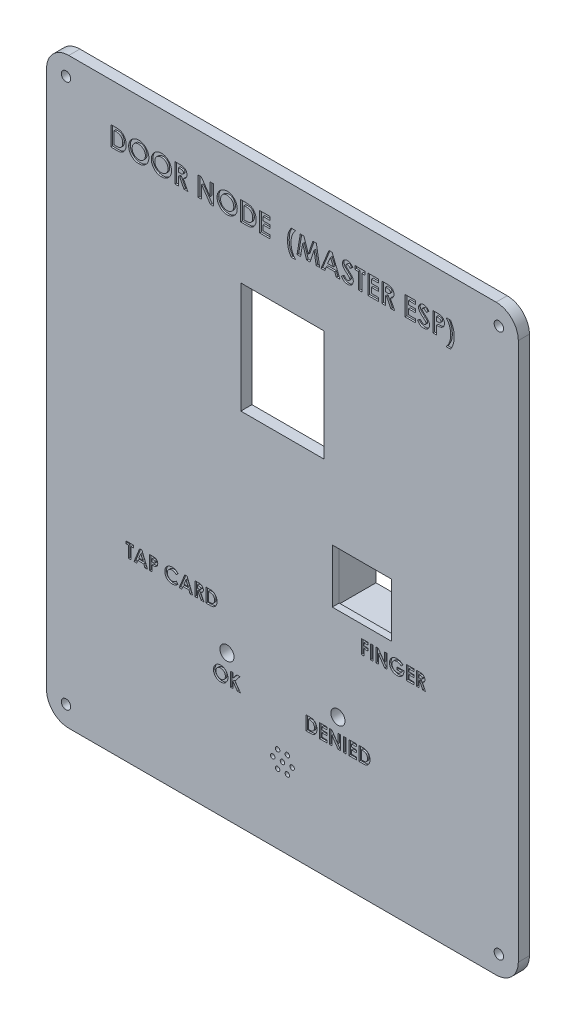
from build123d import *

# Parameters (mm, degrees)
PANEL_DEPTH                    = 4
SKETCH2_R                      = 1.7
SCREW_HOLES_DEPTH              = 227.585524692
SKETCH3_W                      = 30
SKETCH3_H                      = 2
SKETCH3_W_2                    = 2
SKETCH3_H_2                    = 30
LOCATING_TABS_DEPTH            = 3
SKETCH4_W                      = 30
SKETCH4_H                      = 40
TFT_WINDOW_DEPTH               = 227.585524692
SKETCH5_R                      = 2.1
TFT_BOSSES_DEPTH               = 2.4
SKETCH6_R                      = 1.1
TFT_PILOT_HOLES_DEPTH          = 4
SKETCH7_W                      = 43.6
SKETCH7_H                      = 41.4
SKETCH7_R                      = 3
NFC_POCKET_DEPTH               = 2.5
SKETCH8_R                      = 1.1
NFC_PILOT_HOLES_DEPTH          = 3
SKETCH9_W                      = 49.6
SKETCH9_H                      = 47.4
NFC_TAP_OUTLINE_RECESS_DEPTH   = 0.6
SKETCH10_W                     = 49.6
SKETCH10_H                     = 47.4
NFC_TAP_OUTLINE_FILL_DEPTH     = 0.6
SKETCH11_W                     = 44.6
SKETCH11_H                     = 20.5
FINGERPRINT_POCKET_DEPTH       = 1.5
SKETCH12_W                     = 21.4
SKETCH12_H                     = 19.4
FINGERPRINT_APERTURE_DEPTH     = 227.585524692
SKETCH13_W                     = 46.6
SKETCH13_H                     = 2
FINGERPRINT_CRADLE_SIDES_DEPTH = 12
SKETCH14_W                     = 2
SKETCH14_H                     = 20.5
FINGERPRINT_CRADLE_END_DEPTH   = 12
SKETCH15_W                     = 4
SKETCH15_H                     = 2.5
FINGERPRINT_TIE_SLOTS_DEPTH    = 139.15593545
SKETCH16_R                     = 2.55
LED_HOLES_DEPTH                = 227.867802916
SKETCH17_R                     = 0.8
BUZZER_SOUND_HOLES_DEPTH       = 227.867802916
SKETCH18_R                     = 7.85
SKETCH18_R_2                   = 6.25
BUZZER_CRADLE_DEPTH            = 7
SKETCH19_W                     = 0.897435897
SKETCH19_H                     = 5
SKETCH19_W_2                   = 0.897435898
LABELS_ENGRAVED_DEPTH          = 0.6


with BuildPart() as part:
    # Sketch1 → Panel (new body)
    with BuildSketch(Plane.XY):
        with BuildLine():
            Line((-77, 0), (77, 0))
            ThreePointArc((77, 0), (82.656854249, 2.343145751), (85, 8))
            Line((85, 8), (85, 202))
            ThreePointArc((85, 202), (82.656854249, 207.656854249), (77, 210))
            Line((77, 210), (-77, 210))
            ThreePointArc((-77, 210), (-82.656854249, 207.656854249), (-85, 202))
            Line((-85, 202), (-85, 8))
            ThreePointArc((-85, 8), (-82.656854249, 2.343145751), (-77, 0))
        make_face()
    extrude(amount=PANEL_DEPTH)

    # Sketch2 → Screw holes (cut, through all)
    with BuildSketch(Plane.XY):
        with Locations((-78, 7)):
            Circle(SKETCH2_R)
        with Locations((78, 7)):
            Circle(SKETCH2_R)
        with Locations((-78, 203)):
            Circle(SKETCH2_R)
        with Locations((78, 203)):
            Circle(SKETCH2_R)
    extrude(amount=SCREW_HOLES_DEPTH, mode=Mode.SUBTRACT)

    # Sketch3 → Locating tabs (add)
    with BuildSketch(Plane.XY.offset(-3)):
        with Locations((0, 4.3)):
            Rectangle(SKETCH3_W, SKETCH3_H)
        with Locations((0, 205.7)):
            Rectangle(SKETCH3_W, SKETCH3_H)
        with Locations((-80.7, 105)):
            Rectangle(SKETCH3_W_2, SKETCH3_H_2)
        with Locations((80.7, 105)):
            Rectangle(SKETCH3_W_2, SKETCH3_H_2)
    extrude(amount=LOCATING_TABS_DEPTH)

    # Sketch4 → TFT window (cut, through all)
    with BuildSketch(Plane.XY):
        with Locations((0, 150)):
            Rectangle(SKETCH4_W, SKETCH4_H)
    extrude(amount=TFT_WINDOW_DEPTH, mode=Mode.SUBTRACT)

    # Sketch5 → TFT bosses (add)
    with BuildSketch(Plane.XY.offset(-2.4)):
        with Locations((-14.25, 124)):
            Circle(SKETCH5_R)
        with Locations((-14.25, 176)):
            Circle(SKETCH5_R)
        with Locations((14.25, 124)):
            Circle(SKETCH5_R)
        with Locations((14.25, 176)):
            Circle(SKETCH5_R)
    extrude(amount=TFT_BOSSES_DEPTH)

    # Sketch6 → TFT pilot holes (cut)
    with BuildSketch(Plane.XY.offset(-2.4)):
        with Locations((-14.25, 124)):
            Circle(SKETCH6_R)
        with Locations((-14.25, 176)):
            Circle(SKETCH6_R)
        with Locations((14.25, 124)):
            Circle(SKETCH6_R)
        with Locations((14.25, 176)):
            Circle(SKETCH6_R)
    extrude(amount=TFT_PILOT_HOLES_DEPTH, mode=Mode.SUBTRACT)

    # Sketch7 → NFC pocket (cut)
    with BuildSketch(Plane.XY):
        with Locations((-40, 95)):
            Rectangle(SKETCH7_W, SKETCH7_H)
        with Locations((-53.9, 82.4)):
            Circle(SKETCH7_R, mode=Mode.SUBTRACT)
        with Locations((-53.9, 107.6)):
            Circle(SKETCH7_R, mode=Mode.SUBTRACT)
        with Locations((-26.1, 82.4)):
            Circle(SKETCH7_R, mode=Mode.SUBTRACT)
        with Locations((-26.1, 107.6)):
            Circle(SKETCH7_R, mode=Mode.SUBTRACT)
    extrude(amount=NFC_POCKET_DEPTH, mode=Mode.SUBTRACT)

    # Sketch8 → NFC pilot holes (cut)
    with BuildSketch(Plane.XY):
        with Locations((-53.9, 82.4)):
            Circle(SKETCH8_R)
        with Locations((-53.9, 107.6)):
            Circle(SKETCH8_R)
        with Locations((-26.1, 82.4)):
            Circle(SKETCH8_R)
        with Locations((-26.1, 107.6)):
            Circle(SKETCH8_R)
    extrude(amount=NFC_PILOT_HOLES_DEPTH, mode=Mode.SUBTRACT)

    # Sketch9 → NFC tap outline recess (cut)
    with BuildSketch(Plane.XY.offset(4)):
        with Locations((-40, 95)):
            Rectangle(SKETCH9_W, SKETCH9_H)
    extrude(amount=-NFC_TAP_OUTLINE_RECESS_DEPTH, mode=Mode.SUBTRACT)

    # Sketch10 → NFC tap outline fill (add)
    with BuildSketch(Plane.XY.offset(3.4)):
        with Locations((-40, 95)):
            Rectangle(SKETCH10_W, SKETCH10_H)
    extrude(amount=NFC_TAP_OUTLINE_FILL_DEPTH)

    # Sketch11 → Fingerprint pocket (cut)
    with BuildSketch(Plane.XY):
        with Locations((40, 95)):
            Rectangle(SKETCH11_W, SKETCH11_H)
    extrude(amount=FINGERPRINT_POCKET_DEPTH, mode=Mode.SUBTRACT)

    # Sketch12 → Fingerprint aperture (cut, through all)
    with BuildSketch(Plane.XY):
        with Locations((28.65, 95)):
            Rectangle(SKETCH12_W, SKETCH12_H)
    extrude(amount=FINGERPRINT_APERTURE_DEPTH, mode=Mode.SUBTRACT)

    # Sketch13 → Fingerprint cradle sides (add)
    with BuildSketch(Plane.XY.offset(-12)):
        with Locations((39, 106.25)):
            Rectangle(SKETCH13_W, SKETCH13_H)
        with Locations((39, 83.75)):
            Rectangle(SKETCH13_W, SKETCH13_H)
    extrude(amount=FINGERPRINT_CRADLE_SIDES_DEPTH)

    # Sketch14 → Fingerprint cradle end (add)
    with BuildSketch(Plane.XY.offset(-12)):
        with Locations((16.7, 95)):
            Rectangle(SKETCH14_W, SKETCH14_H)
    extrude(amount=FINGERPRINT_CRADLE_END_DEPTH)

    # Sketch15 → Fingerprint tie slots (cut, through all)
    with BuildSketch(Plane(origin=(0, 108.25, 0), x_dir=(1, 0, 0), z_dir=(0, 1, 0))):
        with Locations((30, 9.25)):
            Rectangle(SKETCH15_W, SKETCH15_H)
    extrude(amount=-FINGERPRINT_TIE_SLOTS_DEPTH, mode=Mode.SUBTRACT)

    # Sketch16 → LED holes (cut, through all)
    with BuildSketch(Plane.XY):
        with Locations((-20, 52)):
            Circle(SKETCH16_R)
        with Locations((20, 52)):
            Circle(SKETCH16_R)
    extrude(amount=LED_HOLES_DEPTH, mode=Mode.SUBTRACT)

    # Sketch17 → Buzzer sound holes (cut, through all)
    with BuildSketch(Plane.XY):
        with Locations((0, 28)):
            Circle(SKETCH17_R)
        with Locations((3.5, 28)):
            Circle(SKETCH17_R)
        with Locations((1.75, 31.031088913)):
            Circle(SKETCH17_R)
        with Locations((-1.75, 31.031088913)):
            Circle(SKETCH17_R)
        with Locations((-3.5, 28)):
            Circle(SKETCH17_R)
        with Locations((-1.75, 24.968911087)):
            Circle(SKETCH17_R)
        with Locations((1.75, 24.968911087)):
            Circle(SKETCH17_R)
    extrude(amount=BUZZER_SOUND_HOLES_DEPTH, mode=Mode.SUBTRACT)

    # Sketch18 → Buzzer cradle (add)
    with BuildSketch(Plane.XY.offset(-7)):
        with Locations((0, 28)):
            Circle(SKETCH18_R)
        with Locations((0, 28)):
            Circle(SKETCH18_R_2, mode=Mode.SUBTRACT)
    extrude(amount=BUZZER_CRADLE_DEPTH)

    # Sketch19 → Labels (engraved) (cut)
    # profile 1 of 40: a face of its own
    with BuildSketch(Plane.XY.offset(4)):
        with BuildLine():
            Line((-61.878205128, 196), (-60.295072115, 196))
            add(Edge.make_bspline(
                [(-60.295072115, 196), (-60.171648688, 195.999137228), (-59.933069807, 195.99746948), (-59.587416207, 195.97867797), (-59.266002345, 195.949777963), (-58.96862103, 195.910020765), (-58.695881942, 195.857411104), (-58.448136773, 195.791422597), (-58.224554031, 195.715249843), (-58.022682176, 195.625617141), (-57.83839259, 195.521114312), (-57.663403746, 195.404706551), (-57.498059231, 195.2721295), (-57.340038697, 195.125940836), (-57.191381431, 194.963466082), (-57.049611757, 194.787396408), (-56.918200842, 194.595178561), (-56.793176416, 194.391421319), (-56.680108459, 194.175261178), (-56.581486362, 193.948538048), (-56.498870033, 193.712710978), (-56.431739988, 193.467528636), (-56.378229595, 193.213804954), (-56.340789451, 192.951027941), (-56.317643581, 192.679440884), (-56.315295626, 192.495373), (-56.314102564, 192.401842949)],
                knots=[0, 0, 0, 0, 1.44355588, 2.790409838, 4.047694926, 5.217575253, 6.298404546, 7.294384826, 8.214239204, 9.058592145, 9.873746385, 10.689560431, 11.514393297, 12.350027578, 13.205127629, 14.088021785, 14.991911688, 15.926770944, 16.882954281, 17.842803888, 18.816321264, 19.80318086, 20.814351908, 21.847355356, 22.906180909, 24, 24, 24, 24], degree=3))
            add(Edge.make_bspline(
                [(-56.314102564, 192.401842949), (-56.317226644, 192.269865958), (-56.323376578, 192.010061526), (-56.375180185, 191.628801515), (-56.458964158, 191.263325768), (-56.576772035, 190.916493178), (-56.722822265, 190.591392341), (-56.897295619, 190.293756274), (-57.097633912, 190.025182535), (-57.321503191, 189.787008403), (-57.563899097, 189.582294508), (-57.815797323, 189.406972038), (-58.079651816, 189.268715641), (-58.312144499, 189.181040411), (-58.51374466, 189.126514003), (-58.690747421, 189.09428837), (-58.891804497, 189.064735522), (-59.118790571, 189.041897717), (-59.370709904, 189.021532006), (-59.648566649, 189.010466072), (-59.951461187, 189.001271924), (-60.161850083, 189.000435084), (-60.271233974, 189)],
                knots=[0, 0, 0, 0, 1.315458931, 2.589557908, 3.828601765, 5.048913369, 6.235739168, 7.376350998, 8.481830359, 9.569842114, 10.627874879, 11.640079404, 12.624025415, 13.590060155, 14.111227486, 14.704434459, 15.382649715, 16.137166398, 16.978595427, 17.902333227, 18.909396075, 20, 20, 20, 20], degree=3))
            Line((-60.271233974, 189), (-61.878205128, 189))
            Line((-61.878205128, 189), (-61.878205128, 196))
        make_face()
        with BuildLine():
            Line((-60.621794872, 194.743589744), (-60.621794872, 190.256410256))
            Line((-60.621794872, 190.256410256), (-59.965544872, 190.256410256))
            add(Edge.make_bspline(
                [(-59.965544872, 190.256410256), (-59.8874612, 190.256553338), (-59.737280306, 190.256828532), (-59.520453089, 190.269936239), (-59.319942892, 190.283092763), (-59.136301671, 190.308064285), (-58.968192945, 190.335880803), (-58.817926085, 190.374591297), (-58.682403439, 190.415253392), (-58.563280391, 190.467021279), (-58.454173385, 190.52528948), (-58.35315276, 190.593557434), (-58.255639573, 190.669366421), (-58.163456912, 190.754946093), (-58.076255888, 190.849163213), (-57.994552437, 190.952503241), (-57.917256034, 191.064650884), (-57.846350732, 191.186199093), (-57.781557088, 191.315864292), (-57.724077865, 191.452390485), (-57.676419107, 191.596914641), (-57.636808066, 191.748083839), (-57.608501485, 191.907214179), (-57.585083188, 192.073127006), (-57.573010374, 192.246479651), (-57.571353456, 192.364434585), (-57.570512821, 192.424278846)],
                knots=[0, 0, 0, 0, 1.50275155, 2.890291501, 4.180787663, 5.369391935, 6.45668281, 7.458360028, 8.354766181, 9.177074746, 9.954075863, 10.732690366, 11.5210699, 12.329727389, 13.151100085, 13.990027547, 14.863562427, 15.770965086, 16.696477834, 17.652329173, 18.619756807, 19.62365428, 20.657822005, 21.729286259, 22.847956731, 24, 24, 24, 24], degree=3))
            add(Edge.make_bspline(
                [(-57.570512821, 192.424278846), (-57.57218708, 192.51598452), (-57.575451757, 192.694803477), (-57.606935596, 192.955257193), (-57.658185278, 193.200513383), (-57.731313638, 193.429661837), (-57.823494201, 193.643346583), (-57.938879664, 193.839757258), (-58.072504281, 194.02219329), (-58.178170982, 194.129216121), (-58.230969551, 194.182692308)],
                knots=[0, 0, 0, 0, 1.13821349, 2.219428113, 3.251817212, 4.244760574, 5.201143372, 6.134805572, 7.068016741, 8, 8, 8, 8], degree=3))
            add(Edge.make_bspline(
                [(-58.230969551, 194.182692308), (-58.28303394, 194.228261248), (-58.389369557, 194.32133065), (-58.576059959, 194.432851594), (-58.781783112, 194.530833674), (-59.011245346, 194.608522537), (-59.26222901, 194.669962201), (-59.536228969, 194.712335635), (-59.831777893, 194.739564355), (-60.036527301, 194.742219201), (-60.142227564, 194.743589744)],
                knots=[0, 0, 0, 0, 0.813307809, 1.661089106, 2.549956539, 3.493439533, 4.508053171, 5.589449661, 6.755572447, 8, 8, 8, 8], degree=3))
            Line((-60.142227564, 194.743589744), (-60.621794872, 194.743589744))
        make_face(mode=Mode.SUBTRACT)
    # profile 2 of 40: a face of its own
    with BuildSketch(Plane.XY.offset(4)):
        with BuildLine():
            add(Edge.make_bspline(
                [(-51.768028846, 196.179487179), (-51.646325267, 196.176336056), (-51.406054837, 196.170115024), (-51.052703739, 196.11825787), (-50.712184621, 196.033764071), (-50.384651466, 195.916311579), (-50.070924379, 195.762719183), (-49.76989674, 195.57734133), (-49.482646814, 195.356679122), (-49.212118109, 195.105880246), (-48.962100795, 194.833147419), (-48.745460646, 194.539502043), (-48.560717875, 194.232552764), (-48.407602572, 193.911477103), (-48.29097677, 193.574051457), (-48.20913562, 193.221996252), (-48.156556736, 192.855411644), (-48.150509356, 192.605817493), (-48.147435897, 192.478966346)],
                knots=[0, 0, 0, 0, 1.014329547, 2.002516266, 2.970391464, 3.935626869, 4.897733899, 5.877609409, 6.878433252, 7.912639331, 8.949961323, 9.958554974, 10.949718813, 11.932905612, 12.9188844, 13.919928257, 14.942845884, 16, 16, 16, 16], degree=3))
            add(Edge.make_bspline(
                [(-48.147435897, 192.478966346), (-48.150708997, 192.353544519), (-48.157158746, 192.106396785), (-48.20698912, 191.743190399), (-48.290208485, 191.394906439), (-48.404856222, 191.060756556), (-48.555194593, 190.742359259), (-48.736334678, 190.437681624), (-48.953056422, 190.149551132), (-49.197455132, 189.878122407), (-49.4665169, 189.631742596), (-49.751496027, 189.414620814), (-50.051076653, 189.230640009), (-50.364820288, 189.079884454), (-50.693399741, 188.962888619), (-51.036003381, 188.880339557), (-51.392610006, 188.830172825), (-51.635119804, 188.823765206), (-51.758213141, 188.820512821)],
                knots=[0, 0, 0, 0, 1.051557043, 2.072126891, 3.067553643, 4.050577992, 5.02905126, 6.015227836, 7.017913613, 8.04756643, 9.074058332, 10.072836633, 11.047628519, 12.017157415, 12.98668631, 13.966869689, 14.968021931, 16, 16, 16, 16], degree=3))
            add(Edge.make_bspline(
                [(-51.758213141, 188.820512821), (-51.886954012, 188.82343037), (-52.139912225, 188.829162956), (-52.510117702, 188.883677235), (-52.864806538, 188.965794782), (-53.200999142, 189.088350815), (-53.522119348, 189.241556163), (-53.825807792, 189.430237733), (-54.111962415, 189.654083716), (-54.378941786, 189.907361332), (-54.620825743, 190.184502596), (-54.83433578, 190.477277765), (-55.014436234, 190.783450294), (-55.161133692, 191.103163478), (-55.276784075, 191.434430378), (-55.35836228, 191.779268505), (-55.406552472, 192.136850811), (-55.413265086, 192.379727861), (-55.416666667, 192.502804487)],
                knots=[0, 0, 0, 0, 1.067978421, 2.098431617, 3.099715153, 4.085208694, 5.062210972, 6.048429807, 7.046490867, 8.072918869, 9.098532598, 10.095778865, 11.076610158, 12.041847152, 13.011192615, 13.984257998, 14.978533688, 16, 16, 16, 16], degree=3))
            add(Edge.make_bspline(
                [(-55.416666667, 192.502804487), (-55.415599055, 192.585603998), (-55.413477349, 192.750154589), (-55.387919171, 192.994010164), (-55.351122743, 193.233106006), (-55.296702571, 193.466488836), (-55.230595972, 193.695805061), (-55.144945534, 193.918920149), (-55.047452157, 194.138217583), (-54.933540326, 194.351107186), (-54.806881383, 194.555630195), (-54.668685201, 194.750821839), (-54.518604285, 194.934321967), (-54.357122096, 195.107336465), (-54.183682145, 195.268728097), (-54.000565856, 195.420781585), (-53.804221838, 195.55945785), (-53.598947446, 195.68814364), (-53.38589997, 195.804511969), (-53.165946706, 195.90356121), (-52.943619127, 195.990059226), (-52.715947234, 196.058327284), (-52.485370939, 196.113930903), (-52.249426999, 196.150702531), (-52.010247036, 196.176260001), (-51.848959853, 196.1784089), (-51.768028846, 196.179487179)],
                knots=[0, 0, 0, 0, 1.034744296, 2.056386356, 3.06226378, 4.057406941, 5.050368692, 6.043467995, 7.042652155, 8.049140477, 9.059438543, 10.048523776, 11.036952808, 12.020949711, 13.004946614, 13.997082645, 14.994316842, 16.007702937, 17.024872941, 18.026463647, 19.021641123, 20.005082605, 20.995858141, 21.984425357, 22.988620895, 24, 24, 24, 24], degree=3))
        make_face()
        with BuildLine():
            add(Edge.make_bspline(
                [(-51.787660256, 194.923076923), (-51.869566749, 194.920879188), (-52.031217389, 194.916541738), (-52.268329439, 194.883496239), (-52.495965381, 194.83071882), (-52.712863338, 194.754271373), (-52.919963366, 194.656973176), (-53.117632588, 194.539164201), (-53.303133694, 194.396794894), (-53.478940162, 194.237508431), (-53.637752377, 194.060026704), (-53.778067979, 193.86982485), (-53.895489537, 193.667220503), (-53.993830828, 193.454095808), (-54.067860025, 193.228054236), (-54.120588802, 192.990866394), (-54.153911421, 192.742123597), (-54.158111778, 192.572555955), (-54.16025641, 192.485977564)],
                knots=[0, 0, 0, 0, 1.033739768, 2.040188636, 3.016340934, 3.979330865, 4.937572243, 5.900995986, 6.878200029, 7.884839167, 8.891893314, 9.879764717, 10.863503415, 11.843163062, 12.837761627, 13.859916423, 14.907309254, 16, 16, 16, 16], degree=3))
            add(Edge.make_bspline(
                [(-54.16025641, 192.485977564), (-54.157412956, 192.390029231), (-54.151840256, 192.201986397), (-54.112630061, 191.927674577), (-54.045545321, 191.668614288), (-53.948676261, 191.426072556), (-53.828533212, 191.197356136), (-53.679334613, 190.985268273), (-53.503496776, 190.788539084), (-53.36803273, 190.673680389), (-53.299278846, 190.615384615)],
                knots=[0, 0, 0, 0, 1.078454662, 2.113592447, 3.107694534, 4.079536787, 5.043276885, 6.005368276, 6.987637804, 8, 8, 8, 8], degree=3))
            add(Edge.make_bspline(
                [(-53.299278846, 190.615384615), (-53.242956289, 190.572317936), (-53.131580132, 190.487154878), (-52.953799536, 190.378000948), (-52.770720529, 190.284445142), (-52.580961551, 190.208853157), (-52.384923361, 190.149393772), (-52.182632844, 190.107755343), (-51.974376628, 190.081623627), (-51.833544014, 190.078500392), (-51.762419872, 190.076923077)],
                knots=[0, 0, 0, 0, 1.023928204, 2.024787132, 3.009472467, 3.9914905, 4.972207045, 5.96565515, 6.972602802, 8, 8, 8, 8], degree=3))
            add(Edge.make_bspline(
                [(-51.762419872, 190.076923077), (-51.681921763, 190.079139446), (-51.523539203, 190.083500223), (-51.290841122, 190.116138914), (-51.067909293, 190.171375364), (-50.853359736, 190.247152187), (-50.647811116, 190.345672047), (-50.452268005, 190.467135087), (-50.266387563, 190.610049899), (-50.09080507, 190.771428142), (-49.930314371, 190.949609024), (-49.790291579, 191.140825395), (-49.669136601, 191.340864187), (-49.572840319, 191.552556644), (-49.495886396, 191.773904489), (-49.443792238, 192.005888025), (-49.410188118, 192.247550926), (-49.405986577, 192.412011071), (-49.403846154, 192.495793269)],
                knots=[0, 0, 0, 0, 1.026359118, 2.019393844, 2.989460624, 3.950973911, 4.916101784, 5.890408035, 6.881132271, 7.902007068, 8.92769091, 9.933912415, 10.920395702, 11.90457117, 12.894218921, 13.903490204, 14.931958862, 16, 16, 16, 16], degree=3))
            add(Edge.make_bspline(
                [(-49.403846154, 192.495793269), (-49.406060636, 192.579093697), (-49.410419507, 192.743057885), (-49.443115644, 192.984099473), (-49.498001799, 193.215058869), (-49.574006171, 193.436313255), (-49.67105973, 193.648079541), (-49.791076301, 193.849613034), (-49.933634762, 194.040718898), (-50.095454137, 194.22009482), (-50.271584581, 194.384929803), (-50.460678212, 194.527976604), (-50.657443977, 194.652279726), (-50.866396644, 194.749653772), (-51.083261215, 194.827231469), (-51.309361009, 194.884360798), (-51.545552394, 194.916309592), (-51.706238277, 194.920801039), (-51.787660256, 194.923076923)],
                knots=[0, 0, 0, 0, 1.055025985, 2.07665775, 3.074803781, 4.057872707, 5.035505728, 6.020516407, 7.023567878, 8.050795229, 9.077271434, 10.074415901, 11.050397877, 12.019801805, 12.988065821, 13.964604439, 14.968634123, 16, 16, 16, 16], degree=3))
        make_face(mode=Mode.SUBTRACT)
    # profile 3 of 40: a face of its own
    with BuildSketch(Plane.XY.offset(4)):
        with BuildLine():
            add(Edge.make_bspline(
                [(-43.601362179, 196.179487179), (-43.479658601, 196.176336056), (-43.23938817, 196.170115024), (-42.886037072, 196.11825787), (-42.545517955, 196.033764071), (-42.2179848, 195.916311579), (-41.904257713, 195.762719183), (-41.603230073, 195.57734133), (-41.315980147, 195.356679122), (-41.045451442, 195.105880246), (-40.795434128, 194.833147419), (-40.57879398, 194.539502043), (-40.394051209, 194.232552764), (-40.240935906, 193.911477103), (-40.124310103, 193.574051457), (-40.042468953, 193.221996252), (-39.989890069, 192.855411644), (-39.983842689, 192.605817493), (-39.980769231, 192.478966346)],
                knots=[0, 0, 0, 0, 1.014329547, 2.002516266, 2.970391464, 3.935626869, 4.897733899, 5.877609409, 6.878433252, 7.912639331, 8.949961323, 9.958554974, 10.949718813, 11.932905612, 12.9188844, 13.919928257, 14.942845884, 16, 16, 16, 16], degree=3))
            add(Edge.make_bspline(
                [(-39.980769231, 192.478966346), (-39.984042331, 192.353544519), (-39.990492079, 192.106396785), (-40.040322453, 191.743190399), (-40.123541818, 191.394906439), (-40.238189556, 191.060756556), (-40.388527926, 190.742359259), (-40.569668012, 190.437681624), (-40.786389756, 190.149551132), (-41.030788465, 189.878122407), (-41.299850234, 189.631742596), (-41.58482936, 189.414620814), (-41.884409986, 189.230640009), (-42.198153622, 189.079884454), (-42.526733075, 188.962888619), (-42.869336714, 188.880339557), (-43.225943339, 188.830172825), (-43.468453138, 188.823765206), (-43.591546474, 188.820512821)],
                knots=[0, 0, 0, 0, 1.051557043, 2.072126891, 3.067553643, 4.050577992, 5.02905126, 6.015227836, 7.017913613, 8.04756643, 9.074058332, 10.072836633, 11.047628519, 12.017157415, 12.98668631, 13.966869689, 14.968021931, 16, 16, 16, 16], degree=3))
            add(Edge.make_bspline(
                [(-43.591546474, 188.820512821), (-43.720287345, 188.82343037), (-43.973245558, 188.829162956), (-44.343451036, 188.883677235), (-44.698139872, 188.965794782), (-45.034332476, 189.088350815), (-45.355452682, 189.241556163), (-45.659141126, 189.430237733), (-45.945295748, 189.654083716), (-46.212275119, 189.907361332), (-46.454159076, 190.184502596), (-46.667669114, 190.477277765), (-46.847769567, 190.783450294), (-46.994467025, 191.103163478), (-47.110117408, 191.434430378), (-47.191695613, 191.779268505), (-47.239885805, 192.136850811), (-47.246598419, 192.379727861), (-47.25, 192.502804487)],
                knots=[0, 0, 0, 0, 1.067978421, 2.098431617, 3.099715153, 4.085208694, 5.062210972, 6.048429807, 7.046490867, 8.072918869, 9.098532598, 10.095778865, 11.076610158, 12.041847152, 13.011192615, 13.984257998, 14.978533688, 16, 16, 16, 16], degree=3))
            add(Edge.make_bspline(
                [(-47.25, 192.502804487), (-47.248932388, 192.585603998), (-47.246810682, 192.750154589), (-47.221252504, 192.994010164), (-47.184456076, 193.233106006), (-47.130035904, 193.466488836), (-47.063929305, 193.695805061), (-46.978278868, 193.918920149), (-46.880785491, 194.138217583), (-46.766873659, 194.351107186), (-46.640214717, 194.555630195), (-46.502018534, 194.750821839), (-46.351937618, 194.934321967), (-46.190455429, 195.107336465), (-46.017015479, 195.268728097), (-45.833899189, 195.420781585), (-45.637555171, 195.55945785), (-45.43228078, 195.68814364), (-45.219233303, 195.804511969), (-44.99928004, 195.90356121), (-44.77695246, 195.990059226), (-44.549280568, 196.058327284), (-44.318704272, 196.113930903), (-44.082760333, 196.150702531), (-43.843580369, 196.176260001), (-43.682293187, 196.1784089), (-43.601362179, 196.179487179)],
                knots=[0, 0, 0, 0, 1.034744296, 2.056386356, 3.06226378, 4.057406941, 5.050368692, 6.043467995, 7.042652155, 8.049140477, 9.059438543, 10.048523776, 11.036952808, 12.020949711, 13.004946614, 13.997082645, 14.994316842, 16.007702937, 17.024872941, 18.026463647, 19.021641123, 20.005082605, 20.995858141, 21.984425357, 22.988620895, 24, 24, 24, 24], degree=3))
        make_face()
        with BuildLine():
            add(Edge.make_bspline(
                [(-43.62099359, 194.923076923), (-43.702900082, 194.920879188), (-43.864550722, 194.916541738), (-44.101662773, 194.883496239), (-44.329298714, 194.83071882), (-44.546196672, 194.754271373), (-44.753296699, 194.656973176), (-44.950965921, 194.539164201), (-45.136467027, 194.396794894), (-45.312273496, 194.237508431), (-45.47108571, 194.060026704), (-45.611401312, 193.86982485), (-45.728822871, 193.667220503), (-45.827164162, 193.454095808), (-45.901193358, 193.228054236), (-45.953922135, 192.990866394), (-45.987244754, 192.742123597), (-45.991445112, 192.572555955), (-45.993589744, 192.485977564)],
                knots=[0, 0, 0, 0, 1.033739768, 2.040188636, 3.016340934, 3.979330865, 4.937572243, 5.900995986, 6.878200029, 7.884839167, 8.891893314, 9.879764717, 10.863503415, 11.843163062, 12.837761627, 13.859916423, 14.907309254, 16, 16, 16, 16], degree=3))
            add(Edge.make_bspline(
                [(-45.993589744, 192.485977564), (-45.990746289, 192.390029231), (-45.985173589, 192.201986397), (-45.945963394, 191.927674577), (-45.878878654, 191.668614288), (-45.782009594, 191.426072556), (-45.661866545, 191.197356136), (-45.512667947, 190.985268273), (-45.336830109, 190.788539084), (-45.201366064, 190.673680389), (-45.132612179, 190.615384615)],
                knots=[0, 0, 0, 0, 1.078454662, 2.113592447, 3.107694534, 4.079536787, 5.043276885, 6.005368276, 6.987637804, 8, 8, 8, 8], degree=3))
            add(Edge.make_bspline(
                [(-45.132612179, 190.615384615), (-45.076289622, 190.572317936), (-44.964913465, 190.487154878), (-44.78713287, 190.378000948), (-44.604053863, 190.284445142), (-44.414294884, 190.208853157), (-44.218256695, 190.149393772), (-44.015966177, 190.107755343), (-43.807709961, 190.081623627), (-43.666877347, 190.078500392), (-43.595753205, 190.076923077)],
                knots=[0, 0, 0, 0, 1.023928204, 2.024787132, 3.009472467, 3.9914905, 4.972207045, 5.96565515, 6.972602802, 8, 8, 8, 8], degree=3))
            add(Edge.make_bspline(
                [(-43.595753205, 190.076923077), (-43.515255097, 190.079139446), (-43.356872537, 190.083500223), (-43.124174456, 190.116138914), (-42.901242626, 190.171375364), (-42.686693069, 190.247152187), (-42.481144449, 190.345672047), (-42.285601338, 190.467135087), (-42.099720896, 190.610049899), (-41.924138403, 190.771428142), (-41.763647704, 190.949609024), (-41.623624912, 191.140825395), (-41.502469935, 191.340864187), (-41.406173652, 191.552556644), (-41.32921973, 191.773904489), (-41.277125571, 192.005888025), (-41.243521452, 192.247550926), (-41.239319911, 192.412011071), (-41.237179487, 192.495793269)],
                knots=[0, 0, 0, 0, 1.026359118, 2.019393844, 2.989460624, 3.950973911, 4.916101784, 5.890408035, 6.881132271, 7.902007068, 8.92769091, 9.933912415, 10.920395702, 11.90457117, 12.894218921, 13.903490204, 14.931958862, 16, 16, 16, 16], degree=3))
            add(Edge.make_bspline(
                [(-41.237179487, 192.495793269), (-41.23939397, 192.579093697), (-41.24375284, 192.743057885), (-41.276448978, 192.984099473), (-41.331335132, 193.215058869), (-41.407339505, 193.436313255), (-41.504393063, 193.648079541), (-41.624409635, 193.849613034), (-41.766968095, 194.040718898), (-41.92878747, 194.22009482), (-42.104917915, 194.384929803), (-42.294011546, 194.527976604), (-42.490777311, 194.652279726), (-42.699729977, 194.749653772), (-42.916594548, 194.827231469), (-43.142694342, 194.884360798), (-43.378885727, 194.916309592), (-43.53957161, 194.920801039), (-43.62099359, 194.923076923)],
                knots=[0, 0, 0, 0, 1.055025985, 2.07665775, 3.074803781, 4.057872707, 5.035505728, 6.020516407, 7.023567878, 8.050795229, 9.077271434, 10.074415901, 11.050397877, 12.019801805, 12.988065821, 13.964604439, 14.968634123, 16, 16, 16, 16], degree=3))
        make_face(mode=Mode.SUBTRACT)
    # profile 4 of 40: a face of its own
    with BuildSketch(Plane.XY.offset(4)):
        with BuildLine():
            Line((-38.724358974, 196), (-37.260416667, 196))
            add(Edge.make_bspline(
                [(-37.260416667, 196), (-37.163650526, 195.999656536), (-36.977541979, 195.998995957), (-36.70918362, 195.988573778), (-36.462659562, 195.97407046), (-36.237604804, 195.951938011), (-36.034115627, 195.92259306), (-35.851988089, 195.888000219), (-35.691227513, 195.848574259), (-35.550478104, 195.799446403), (-35.423458723, 195.744030927), (-35.305059001, 195.680357528), (-35.192666864, 195.60913523), (-35.087033531, 195.528489982), (-34.987241025, 195.439872572), (-34.893101081, 195.343193798), (-34.805943984, 195.237633864), (-34.726309413, 195.123859774), (-34.653728912, 195.00417204), (-34.589582972, 194.878406331), (-34.537419387, 194.746475184), (-34.491327268, 194.610285291), (-34.458128607, 194.467889789), (-34.435039425, 194.320674922), (-34.418134429, 194.16812248), (-34.417162472, 194.064485124), (-34.416666667, 194.01161859)],
                knots=[0, 0, 0, 0, 1.749336639, 3.364467119, 4.854658419, 6.213483162, 7.451590619, 8.570285859, 9.5643256, 10.440900261, 11.26203566, 12.067320669, 12.869050712, 13.665104639, 14.467235401, 15.27997916, 16.102287765, 16.939272006, 17.78853747, 18.631303466, 19.488103222, 20.351255419, 21.228522269, 22.127379805, 23.044756219, 24, 24, 24, 24], degree=3))
            add(Edge.make_bspline(
                [(-34.416666667, 194.01161859), (-34.417954591, 193.956438073), (-34.420479976, 193.848239136), (-34.434083073, 193.689303722), (-34.458945261, 193.537245435), (-34.496602662, 193.392509483), (-34.539884954, 193.253294458), (-34.597439299, 193.122168965), (-34.662395066, 192.997225972), (-34.739541132, 192.880232847), (-34.824205171, 192.768590938), (-34.922667667, 192.666577661), (-35.028549764, 192.568710188), (-35.147803479, 192.481118607), (-35.275171997, 192.397880289), (-35.413185998, 192.322444207), (-35.560944754, 192.252914069), (-35.664826478, 192.214139262), (-35.717948718, 192.194310897)],
                knots=[0, 0, 0, 0, 1.099860209, 2.156625411, 3.176576793, 4.16617041, 5.135385252, 6.078461593, 7.016046972, 7.938469504, 8.868247731, 9.803980173, 10.76021508, 11.73834243, 12.748633912, 13.790971185, 14.870363756, 16, 16, 16, 16], degree=3))
            Line((-35.717948718, 192.194310897), (-34.102564103, 189))
            Line((-34.102564103, 189), (-35.499198718, 189))
            Line((-35.499198718, 189), (-37.041666667, 192.051282051))
            Line((-37.041666667, 192.051282051), (-37.467948718, 192.051282051))
            Line((-37.467948718, 192.051282051), (-37.467948718, 189))
            Line((-37.467948718, 189), (-38.724358974, 189))
            Line((-38.724358974, 189), (-38.724358974, 196))
        make_face()
        with BuildLine():
            Line((-37.467948718, 193.307692308), (-36.978565705, 193.307692308))
            add(Edge.make_bspline(
                [(-36.978565705, 193.307692308), (-36.918734564, 193.308366166), (-36.804170784, 193.309656461), (-36.639413022, 193.31564138), (-36.489773682, 193.330062079), (-36.354610161, 193.348282094), (-36.233242329, 193.369319732), (-36.126752745, 193.399467944), (-36.033500566, 193.431772517), (-35.954590834, 193.471918721), (-35.887172172, 193.517573662), (-35.828960473, 193.569438811), (-35.780811051, 193.629466116), (-35.741181621, 193.696024294), (-35.710354233, 193.769702037), (-35.687852601, 193.84969053), (-35.675277517, 193.936900944), (-35.67383071, 193.997088004), (-35.673076923, 194.028445513)],
                knots=[0, 0, 0, 0, 1.688639943, 3.233382647, 4.650958383, 5.928841754, 7.082724185, 8.122798841, 9.049171256, 9.863274652, 10.613301712, 11.341792392, 12.054588806, 12.776240173, 13.521029143, 14.301969904, 15.115324896, 16, 16, 16, 16], degree=3))
            add(Edge.make_bspline(
                [(-35.673076923, 194.028445513), (-35.674502027, 194.065543735), (-35.67730138, 194.138416318), (-35.705079655, 194.243327285), (-35.749296668, 194.340429563), (-35.809906083, 194.42928442), (-35.88623576, 194.507180721), (-35.973830088, 194.575846931), (-36.074579562, 194.630143032), (-36.167865994, 194.665956162), (-36.252734842, 194.687383527), (-36.3293263, 194.70335101), (-36.418019669, 194.714667623), (-36.518881908, 194.726670906), (-36.631655916, 194.734454428), (-36.756956379, 194.740134847), (-36.894423434, 194.742458985), (-36.990251028, 194.743201972), (-37.040264423, 194.743589744)],
                knots=[0, 0, 0, 0, 1.020303359, 2.004196876, 2.966617323, 3.9489082, 4.950758222, 5.960522915, 7.003732012, 8.091992268, 8.70421221, 9.413913587, 10.24622431, 11.166358409, 12.212345909, 13.359657661, 14.621978493, 16, 16, 16, 16], degree=3))
            Line((-37.040264423, 194.743589744), (-37.467948718, 194.743589744))
            Line((-37.467948718, 194.743589744), (-37.467948718, 193.307692308))
        make_face(mode=Mode.SUBTRACT)
    # profile 5 of 40: a face of its own
    with BuildSketch(Plane.XY.offset(4)):
        Polygon((-30.378205128, 196), (-29.246594551, 196), (-26.070512821, 191.393629808), (-26.070512821, 196), (-24.814102564, 196), (-24.814102564, 189), (-25.954126603, 189), (-29.121794872, 193.592347756), (-29.121794872, 189), (-30.378205128, 189), align=None)
    # profile 6 of 40: a face of its own
    with BuildSketch(Plane.XY.offset(4)):
        with BuildLine():
            add(Edge.make_bspline(
                [(-19.909054487, 196.179487179), (-19.787350908, 196.176336056), (-19.547080478, 196.170115024), (-19.19372938, 196.11825787), (-18.853210262, 196.033764071), (-18.525677108, 195.916311579), (-18.21195002, 195.762719183), (-17.910922381, 195.57734133), (-17.623672455, 195.356679122), (-17.35314375, 195.105880246), (-17.103126436, 194.833147419), (-16.886486287, 194.539502043), (-16.701743516, 194.232552764), (-16.548628213, 193.911477103), (-16.432002411, 193.574051457), (-16.350161261, 193.221996252), (-16.297582377, 192.855411644), (-16.291534997, 192.605817493), (-16.288461538, 192.478966346)],
                knots=[0, 0, 0, 0, 1.014329547, 2.002516266, 2.970391464, 3.935626869, 4.897733899, 5.877609409, 6.878433252, 7.912639331, 8.949961323, 9.958554974, 10.949718813, 11.932905612, 12.9188844, 13.919928257, 14.942845884, 16, 16, 16, 16], degree=3))
            add(Edge.make_bspline(
                [(-16.288461538, 192.478966346), (-16.291734638, 192.353544519), (-16.298184387, 192.106396785), (-16.348014761, 191.743190399), (-16.431234126, 191.394906439), (-16.545881863, 191.060756556), (-16.696220234, 190.742359259), (-16.877360319, 190.437681624), (-17.094082063, 190.149551132), (-17.338480773, 189.878122407), (-17.607542541, 189.631742596), (-17.892521668, 189.414620814), (-18.192102294, 189.230640009), (-18.505845929, 189.079884454), (-18.834425382, 188.962888619), (-19.177029022, 188.880339557), (-19.533635647, 188.830172825), (-19.776145445, 188.823765206), (-19.899238782, 188.820512821)],
                knots=[0, 0, 0, 0, 1.051557043, 2.072126891, 3.067553643, 4.050577992, 5.02905126, 6.015227836, 7.017913613, 8.04756643, 9.074058332, 10.072836633, 11.047628519, 12.017157415, 12.98668631, 13.966869689, 14.968021931, 16, 16, 16, 16], degree=3))
            add(Edge.make_bspline(
                [(-19.899238782, 188.820512821), (-20.027979653, 188.82343037), (-20.280937866, 188.829162956), (-20.651143343, 188.883677235), (-21.005832179, 188.965794782), (-21.342024783, 189.088350815), (-21.663144989, 189.241556163), (-21.966833433, 189.430237733), (-22.252988056, 189.654083716), (-22.519967427, 189.907361332), (-22.761851384, 190.184502596), (-22.975361422, 190.477277765), (-23.155461875, 190.783450294), (-23.302159333, 191.103163478), (-23.417809716, 191.434430378), (-23.499387921, 191.779268505), (-23.547578113, 192.136850811), (-23.554290727, 192.379727861), (-23.557692308, 192.502804487)],
                knots=[0, 0, 0, 0, 1.067978421, 2.098431617, 3.099715153, 4.085208694, 5.062210972, 6.048429807, 7.046490867, 8.072918869, 9.098532598, 10.095778865, 11.076610158, 12.041847152, 13.011192615, 13.984257998, 14.978533688, 16, 16, 16, 16], degree=3))
            add(Edge.make_bspline(
                [(-23.557692308, 192.502804487), (-23.556624696, 192.585603998), (-23.55450299, 192.750154589), (-23.528944812, 192.994010164), (-23.492148384, 193.233106006), (-23.437728212, 193.466488836), (-23.371621613, 193.695805061), (-23.285971175, 193.918920149), (-23.188477798, 194.138217583), (-23.074565967, 194.351107186), (-22.947907024, 194.555630195), (-22.809710842, 194.750821839), (-22.659629926, 194.934321967), (-22.498147737, 195.107336465), (-22.324707786, 195.268728097), (-22.141591497, 195.420781585), (-21.945247479, 195.55945785), (-21.739973087, 195.68814364), (-21.526925611, 195.804511969), (-21.306972347, 195.90356121), (-21.084644768, 195.990059226), (-20.856972875, 196.058327284), (-20.62639658, 196.113930903), (-20.390452641, 196.150702531), (-20.151272677, 196.176260001), (-19.989985494, 196.1784089), (-19.909054487, 196.179487179)],
                knots=[0, 0, 0, 0, 1.034744296, 2.056386356, 3.06226378, 4.057406941, 5.050368692, 6.043467995, 7.042652155, 8.049140477, 9.059438543, 10.048523776, 11.036952808, 12.020949711, 13.004946614, 13.997082645, 14.994316842, 16.007702937, 17.024872941, 18.026463647, 19.021641123, 20.005082605, 20.995858141, 21.984425357, 22.988620895, 24, 24, 24, 24], degree=3))
        make_face()
        with BuildLine():
            add(Edge.make_bspline(
                [(-19.928685897, 194.923076923), (-20.01059239, 194.920879188), (-20.17224303, 194.916541738), (-20.40935508, 194.883496239), (-20.636991022, 194.83071882), (-20.853888979, 194.754271373), (-21.060989007, 194.656973176), (-21.258658229, 194.539164201), (-21.444159335, 194.396794894), (-21.619965803, 194.237508431), (-21.778778018, 194.060026704), (-21.91909362, 193.86982485), (-22.036515179, 193.667220503), (-22.134856469, 193.454095808), (-22.208885666, 193.228054236), (-22.261614443, 192.990866394), (-22.294937062, 192.742123597), (-22.299137419, 192.572555955), (-22.301282051, 192.485977564)],
                knots=[0, 0, 0, 0, 1.033739768, 2.040188636, 3.016340934, 3.979330865, 4.937572243, 5.900995986, 6.878200029, 7.884839167, 8.891893314, 9.879764717, 10.863503415, 11.843163062, 12.837761627, 13.859916423, 14.907309254, 16, 16, 16, 16], degree=3))
            add(Edge.make_bspline(
                [(-22.301282051, 192.485977564), (-22.298438597, 192.390029231), (-22.292865897, 192.201986397), (-22.253655702, 191.927674577), (-22.186570962, 191.668614288), (-22.089701902, 191.426072556), (-21.969558853, 191.197356136), (-21.820360254, 190.985268273), (-21.644522417, 190.788539084), (-21.509058371, 190.673680389), (-21.440304487, 190.615384615)],
                knots=[0, 0, 0, 0, 1.078454662, 2.113592447, 3.107694534, 4.079536787, 5.043276885, 6.005368276, 6.987637804, 8, 8, 8, 8], degree=3))
            add(Edge.make_bspline(
                [(-21.440304487, 190.615384615), (-21.38398193, 190.572317936), (-21.272605773, 190.487154878), (-21.094825177, 190.378000948), (-20.91174617, 190.284445142), (-20.721987192, 190.208853157), (-20.525949002, 190.149393772), (-20.323658485, 190.107755343), (-20.115402269, 190.081623627), (-19.974569655, 190.078500392), (-19.903445513, 190.076923077)],
                knots=[0, 0, 0, 0, 1.023928204, 2.024787132, 3.009472467, 3.9914905, 4.972207045, 5.96565515, 6.972602802, 8, 8, 8, 8], degree=3))
            add(Edge.make_bspline(
                [(-19.903445513, 190.076923077), (-19.822947404, 190.079139446), (-19.664564844, 190.083500223), (-19.431866763, 190.116138914), (-19.208934934, 190.171375364), (-18.994385377, 190.247152187), (-18.788836757, 190.345672047), (-18.593293646, 190.467135087), (-18.407413204, 190.610049899), (-18.231830711, 190.771428142), (-18.071340012, 190.949609024), (-17.93131722, 191.140825395), (-17.810162242, 191.340864187), (-17.71386596, 191.552556644), (-17.636912037, 191.773904489), (-17.584817879, 192.005888025), (-17.551213759, 192.247550926), (-17.547012218, 192.412011071), (-17.544871795, 192.495793269)],
                knots=[0, 0, 0, 0, 1.026359118, 2.019393844, 2.989460624, 3.950973911, 4.916101784, 5.890408035, 6.881132271, 7.902007068, 8.92769091, 9.933912415, 10.920395702, 11.90457117, 12.894218921, 13.903490204, 14.931958862, 16, 16, 16, 16], degree=3))
            add(Edge.make_bspline(
                [(-17.544871795, 192.495793269), (-17.547086277, 192.579093697), (-17.551445148, 192.743057885), (-17.584141285, 192.984099473), (-17.63902744, 193.215058869), (-17.715031812, 193.436313255), (-17.812085371, 193.648079541), (-17.932101942, 193.849613034), (-18.074660403, 194.040718898), (-18.236479778, 194.22009482), (-18.412610222, 194.384929803), (-18.601703853, 194.527976604), (-18.798469619, 194.652279726), (-19.007422285, 194.749653772), (-19.224286856, 194.827231469), (-19.45038665, 194.884360798), (-19.686578035, 194.916309592), (-19.847263918, 194.920801039), (-19.928685897, 194.923076923)],
                knots=[0, 0, 0, 0, 1.055025985, 2.07665775, 3.074803781, 4.057872707, 5.035505728, 6.020516407, 7.023567878, 8.050795229, 9.077271434, 10.074415901, 11.050397877, 12.019801805, 12.988065821, 13.964604439, 14.968634123, 16, 16, 16, 16], degree=3))
        make_face(mode=Mode.SUBTRACT)
    # profile 7 of 40: a face of its own
    with BuildSketch(Plane.XY.offset(4)):
        with BuildLine():
            Line((-15.032051282, 196), (-13.448918269, 196))
            add(Edge.make_bspline(
                [(-13.448918269, 196), (-13.325494842, 195.999137228), (-13.086915961, 195.99746948), (-12.741262361, 195.97867797), (-12.419848499, 195.949777963), (-12.122467184, 195.910020765), (-11.849728096, 195.857411104), (-11.601982927, 195.791422597), (-11.378400184, 195.715249843), (-11.17652833, 195.625617141), (-10.992238744, 195.521114312), (-10.8172499, 195.404706551), (-10.651905385, 195.2721295), (-10.49388485, 195.125940836), (-10.345227584, 194.963466082), (-10.203457911, 194.787396408), (-10.072046995, 194.595178561), (-9.947022569, 194.391421319), (-9.833954613, 194.175261178), (-9.735332516, 193.948538048), (-9.652716187, 193.712710978), (-9.585586142, 193.467528636), (-9.532075749, 193.213804954), (-9.494635605, 192.951027941), (-9.471489735, 192.679440884), (-9.46914178, 192.495373), (-9.467948718, 192.401842949)],
                knots=[0, 0, 0, 0, 1.44355588, 2.790409838, 4.047694926, 5.217575253, 6.298404546, 7.294384826, 8.214239204, 9.058592145, 9.873746385, 10.689560431, 11.514393297, 12.350027578, 13.205127629, 14.088021785, 14.991911688, 15.926770944, 16.882954281, 17.842803888, 18.816321264, 19.80318086, 20.814351908, 21.847355356, 22.906180909, 24, 24, 24, 24], degree=3))
            add(Edge.make_bspline(
                [(-9.467948718, 192.401842949), (-9.471072798, 192.269865958), (-9.477222731, 192.010061526), (-9.529026339, 191.628801515), (-9.612810312, 191.263325768), (-9.730618188, 190.916493178), (-9.876668419, 190.591392341), (-10.051141773, 190.293756274), (-10.251480066, 190.025182535), (-10.475349345, 189.787008403), (-10.717745251, 189.582294508), (-10.969643477, 189.406972038), (-11.23349797, 189.268715641), (-11.465990653, 189.181040411), (-11.667590814, 189.126514003), (-11.844593575, 189.09428837), (-12.045650651, 189.064735522), (-12.272636724, 189.041897717), (-12.524556057, 189.021532006), (-12.802412803, 189.010466072), (-13.105307341, 189.001271924), (-13.315696237, 189.000435084), (-13.425080128, 189)],
                knots=[0, 0, 0, 0, 1.315458931, 2.589557908, 3.828601765, 5.048913369, 6.235739168, 7.376350998, 8.481830359, 9.569842114, 10.627874879, 11.640079404, 12.624025415, 13.590060155, 14.111227486, 14.704434459, 15.382649715, 16.137166398, 16.978595427, 17.902333227, 18.909396075, 20, 20, 20, 20], degree=3))
            Line((-13.425080128, 189), (-15.032051282, 189))
            Line((-15.032051282, 189), (-15.032051282, 196))
        make_face()
        with BuildLine():
            Line((-13.775641026, 194.743589744), (-13.775641026, 190.256410256))
            Line((-13.775641026, 190.256410256), (-13.119391026, 190.256410256))
            add(Edge.make_bspline(
                [(-13.119391026, 190.256410256), (-13.041307354, 190.256553338), (-12.891126459, 190.256828532), (-12.674299243, 190.269936239), (-12.473789046, 190.283092763), (-12.290147825, 190.308064285), (-12.122039099, 190.335880803), (-11.971772239, 190.374591297), (-11.836249593, 190.415253392), (-11.717126545, 190.467021279), (-11.608019539, 190.52528948), (-11.506998913, 190.593557434), (-11.409485727, 190.669366421), (-11.317303066, 190.754946093), (-11.230102041, 190.849163213), (-11.148398591, 190.952503241), (-11.071102188, 191.064650884), (-11.000196886, 191.186199093), (-10.935403242, 191.315864292), (-10.877924019, 191.452390485), (-10.830265261, 191.596914641), (-10.790654219, 191.748083839), (-10.762347639, 191.907214179), (-10.738929342, 192.073127006), (-10.726856528, 192.246479651), (-10.725199609, 192.364434585), (-10.724358974, 192.424278846)],
                knots=[0, 0, 0, 0, 1.50275155, 2.890291501, 4.180787663, 5.369391935, 6.45668281, 7.458360028, 8.354766181, 9.177074746, 9.954075863, 10.732690366, 11.5210699, 12.329727389, 13.151100085, 13.990027547, 14.863562427, 15.770965086, 16.696477834, 17.652329173, 18.619756807, 19.62365428, 20.657822005, 21.729286259, 22.847956731, 24, 24, 24, 24], degree=3))
            add(Edge.make_bspline(
                [(-10.724358974, 192.424278846), (-10.726033234, 192.51598452), (-10.729297911, 192.694803477), (-10.760781749, 192.955257193), (-10.812031432, 193.200513383), (-10.885159791, 193.429661837), (-10.977340355, 193.643346583), (-11.092725818, 193.839757258), (-11.226350435, 194.02219329), (-11.332017136, 194.129216121), (-11.384815705, 194.182692308)],
                knots=[0, 0, 0, 0, 1.13821349, 2.219428113, 3.251817212, 4.244760574, 5.201143372, 6.134805572, 7.068016741, 8, 8, 8, 8], degree=3))
            add(Edge.make_bspline(
                [(-11.384815705, 194.182692308), (-11.436880093, 194.228261248), (-11.543215711, 194.32133065), (-11.729906112, 194.432851594), (-11.935629266, 194.530833674), (-12.1650915, 194.608522537), (-12.416075164, 194.669962201), (-12.690075123, 194.712335635), (-12.985624047, 194.739564355), (-13.190373455, 194.742219201), (-13.296073718, 194.743589744)],
                knots=[0, 0, 0, 0, 0.813307809, 1.661089106, 2.549956539, 3.493439533, 4.508053171, 5.589449661, 6.755572447, 8, 8, 8, 8], degree=3))
            Line((-13.296073718, 194.743589744), (-13.775641026, 194.743589744))
        make_face(mode=Mode.SUBTRACT)
    # profile 8 of 40: a face of its own
    with BuildSketch(Plane.XY.offset(4)):
        Polygon((-8.211538462, 196), (-4.442307692, 196), (-4.442307692, 194.743589744), (-6.955128205, 194.743589744), (-6.955128205, 193.397435897), (-4.442307692, 193.397435897), (-4.442307692, 192.141025641), (-6.955128205, 192.141025641), (-6.955128205, 190.256410256), (-4.442307692, 190.256410256), (-4.442307692, 189), (-8.211538462, 189), align=None)
    # profile 9 of 40: a face of its own
    with BuildSketch(Plane.XY.offset(4)):
        with BuildLine():
            Line((3.142427885, 196.179487179), (4.711538462, 196.179487179))
            add(Edge.make_bspline(
                [(4.711538462, 196.179487179), (4.644807353, 196.102104022), (4.512307572, 195.948453774), (4.329472803, 195.707669825), (4.157518724, 195.46351904), (3.998904322, 195.213617835), (3.85333024, 194.958395008), (3.719594639, 194.699117576), (3.600278044, 194.434485776), (3.493298938, 194.164595335), (3.398858398, 193.887191234), (3.317607335, 193.60072106), (3.249156472, 193.304908572), (3.192868136, 192.999400166), (3.149633136, 192.684471212), (3.119492021, 192.35928835), (3.098518259, 192.024914812), (3.096948059, 191.79844398), (3.096153846, 191.683894231)],
                knots=[0, 0, 0, 0, 1.00236213, 1.990267575, 2.964862165, 3.931797803, 4.893137898, 5.846900052, 6.793123604, 7.740135921, 8.694427184, 9.667077551, 10.660503013, 11.672460941, 12.714089686, 13.778281025, 14.87624668, 16, 16, 16, 16], degree=3))
            add(Edge.make_bspline(
                [(3.096153846, 191.683894231), (3.097473501, 191.560000798), (3.100074921, 191.315771049), (3.121464337, 190.955056574), (3.156842317, 190.605723155), (3.203308528, 190.267103785), (3.267187061, 189.940771616), (3.342387557, 189.625005798), (3.432969916, 189.321207153), (3.5050759, 189.124923892), (3.540665064, 189.028044872)],
                knots=[0, 0, 0, 0, 1.097990858, 2.164457195, 3.201156713, 4.209415668, 5.192484095, 6.147015238, 7.085427113, 8, 8, 8, 8], degree=3))
            add(Edge.make_bspline(
                [(3.540665064, 189.028044872), (3.571188725, 188.953375688), (3.633520406, 188.80089543), (3.744399418, 188.573626986), (3.868510203, 188.341422672), (4.009141005, 188.105326037), (4.160356652, 187.862281587), (4.331880524, 187.617630774), (4.514648224, 187.366288713), (4.645099115, 187.200050592), (4.711538462, 187.115384615)],
                knots=[0, 0, 0, 0, 0.860028042, 1.756243877, 2.695094802, 3.667075869, 4.686284936, 5.746781471, 6.852423585, 8, 8, 8, 8], degree=3))
            Line((4.711538462, 187.115384615), (3.142427885, 187.115384615))
            add(Edge.make_bspline(
                [(3.142427885, 187.115384615), (3.083274744, 187.212183542), (2.967157041, 187.402199976), (2.808049796, 187.690086959), (2.6583843, 187.970356412), (2.525656324, 188.247943303), (2.403652056, 188.519192052), (2.300001928, 188.787912638), (2.204160162, 189.049638426), (2.125216965, 189.311116712), (2.057778552, 189.575618639), (1.998114626, 189.848567832), (1.950014897, 190.133223788), (1.908837614, 190.429142272), (1.878644121, 190.736534075), (1.856417662, 191.054965964), (1.84168342, 191.384610133), (1.840397198, 191.608156981), (1.83974359, 191.721754808)],
                knots=[0, 0, 0, 0, 1.119871376, 2.19830916, 3.246961562, 4.256259542, 5.235550337, 6.182491613, 7.09917337, 7.986748165, 8.877687696, 9.793695483, 10.744317876, 11.727190303, 12.742913882, 13.793068013, 14.878522868, 16, 16, 16, 16], degree=3))
            add(Edge.make_bspline(
                [(1.83974359, 191.721754808), (1.840277136, 191.833020304), (1.841329083, 192.052392565), (1.85784083, 192.375953161), (1.881590512, 192.689220406), (1.912609277, 192.992096385), (1.957170152, 193.284149783), (2.008107696, 193.565990961), (2.07006716, 193.837305787), (2.141928901, 194.10030167), (2.225596761, 194.358262892), (2.319625039, 194.615706173), (2.426387281, 194.873895838), (2.54605131, 195.133074715), (2.676369157, 195.394356437), (2.8193296, 195.656373274), (2.975331295, 195.918784533), (3.08630572, 196.091925867), (3.142427885, 196.179487179)],
                knots=[0, 0, 0, 0, 1.13127193, 2.230428031, 3.293392423, 4.325815098, 5.325330466, 6.296707414, 7.23754678, 8.15420938, 9.068070667, 9.994306547, 10.940496973, 11.908145907, 12.896524899, 13.908929949, 14.942500703, 16, 16, 16, 16], degree=3))
        make_face()
    # profile 10 of 40: a face of its own
    with BuildSketch(Plane.XY.offset(4)):
        Polygon((6.432091346, 196), (7.733373397, 196), (9.333333333, 191.117387821), (10.941706731, 196), (12.233173077, 196), (13.416666667, 189), (12.144831731, 189), (11.397435897, 193.421274038), (9.941907051, 189), (8.717748397, 189), (7.269230769, 193.421274038), (6.523237179, 189), (5.25, 189), align=None)
    # profile 11 of 40: a face of its own
    with BuildSketch(Plane.XY.offset(4)):
        Polygon((16.735777244, 196), (17.903846154, 196), (20.730769231, 189), (19.388822115, 189), (18.844751603, 190.435897436), (15.797676282, 190.435897436), (15.252203526, 189), (13.91025641, 189), align=None)
        Polygon((17.320512821, 194.122395833), (16.274439103, 191.692307692), (18.367988782, 191.692307692), align=None, mode=Mode.SUBTRACT)
    # profile 12 of 40: a face of its own
    with BuildSketch(Plane.XY.offset(4)):
        with BuildLine():
            Line((25.352564103, 195.064703526), (24.413060897, 194.205128205))
            add(Edge.make_bspline(
                [(24.413060897, 194.205128205), (24.372816609, 194.261896958), (24.295553186, 194.370885048), (24.170317238, 194.516822668), (24.045646794, 194.641318319), (23.920386858, 194.743851915), (23.793427175, 194.823800488), (23.664988127, 194.880404961), (23.535797872, 194.916388962), (23.449001963, 194.920869836), (23.40625, 194.923076923)],
                knots=[0, 0, 0, 0, 1.299362458, 2.494594718, 3.587462134, 4.587049575, 5.512617175, 6.380583204, 7.202344345, 8, 8, 8, 8], degree=3))
            add(Edge.make_bspline(
                [(23.40625, 194.923076923), (23.366372195, 194.921678411), (23.28937863, 194.918978252), (23.179618592, 194.892138875), (23.082172067, 194.84581805), (22.997134158, 194.785249675), (22.929771588, 194.712278825), (22.8759878, 194.635751166), (22.845703008, 194.551281937), (22.841716933, 194.493265063), (22.83974359, 194.464543269)],
                knots=[0, 0, 0, 0, 1.185010067, 2.2879431, 3.333075148, 4.379039566, 5.372662701, 6.27520591, 7.14612461, 8, 8, 8, 8], degree=3))
            add(Edge.make_bspline(
                [(22.83974359, 194.464543269), (22.840980184, 194.435407294), (22.843470513, 194.376731489), (22.867523701, 194.29073479), (22.903778723, 194.206706004), (22.938421876, 194.155553683), (22.956129808, 194.129407051)],
                knots=[0, 0, 0, 0, 0.967525499, 1.948461899, 2.951351359, 4, 4, 4, 4], degree=3))
            add(Edge.make_bspline(
                [(22.956129808, 194.129407051), (22.972228233, 194.109083548), (23.009284682, 194.062301527), (23.07994374, 193.988206099), (23.168676678, 193.897432714), (23.278898125, 193.793102802), (23.406032486, 193.671464252), (23.555972603, 193.537298722), (23.724402546, 193.386451262), (23.844118647, 193.281406552), (23.906850962, 193.226362179)],
                knots=[0, 0, 0, 0, 0.473873513, 1.090794244, 1.870441696, 2.795289791, 3.865433203, 5.087734844, 6.473946851, 8, 8, 8, 8], degree=3))
            add(Edge.make_bspline(
                [(23.906850962, 193.226362179), (23.965734262, 193.175401653), (24.077482534, 193.07868916), (24.236478134, 192.941421305), (24.376208785, 192.817924763), (24.498710046, 192.710052952), (24.602124915, 192.616674051), (24.68688815, 192.53734171), (24.75403499, 192.473600383), (24.792204036, 192.435100582), (24.80849359, 192.418669872)],
                knots=[0, 0, 0, 0, 1.543621617, 2.929473131, 4.163658386, 5.240097082, 6.164993805, 6.925417477, 7.541396219, 8, 8, 8, 8], degree=3))
            add(Edge.make_bspline(
                [(24.80849359, 192.418669872), (24.870292759, 192.351789936), (24.989092464, 192.223223211), (25.143490202, 192.023985221), (25.270564534, 191.829488318), (25.368871648, 191.636072726), (25.443117133, 191.440947843), (25.495461185, 191.239328243), (25.526810385, 191.029107127), (25.530290878, 190.885656878), (25.532051282, 190.813100962)],
                knots=[0, 0, 0, 0, 1.206664779, 2.319633467, 3.337109185, 4.282041471, 5.190008762, 6.099243693, 7.03861361, 8, 8, 8, 8], degree=3))
            add(Edge.make_bspline(
                [(25.532051282, 190.813100962), (25.530798272, 190.742404119), (25.528339819, 190.603694282), (25.498228483, 190.400713097), (25.455291486, 190.206451294), (25.388903357, 190.023022715), (25.307989898, 189.847416437), (25.206553191, 189.682367846), (25.087429687, 189.526206584), (24.950895861, 189.381724223), (24.799873237, 189.250616496), (24.63788712, 189.1339013), (24.463353528, 189.03753804), (24.277763649, 188.958189768), (24.081216824, 188.897074668), (23.8739472, 188.851904913), (23.655637745, 188.824794738), (23.506354593, 188.821960691), (23.430088141, 188.820512821)],
                knots=[0, 0, 0, 0, 1.043214005, 2.046824704, 3.02475056, 3.976699089, 4.921714032, 5.875962561, 6.831408892, 7.817874052, 8.806269674, 9.781291748, 10.760897367, 11.74438705, 12.757449933, 13.795994037, 14.874007457, 16, 16, 16, 16], degree=3))
            add(Edge.make_bspline(
                [(23.430088141, 188.820512821), (23.370219625, 188.821574928), (23.25164563, 188.82367851), (23.076885487, 188.840852503), (22.908134814, 188.868569501), (22.745583692, 188.908296239), (22.588499801, 188.958635404), (22.436876689, 189.020122766), (22.291761061, 189.093711356), (22.152054903, 189.1778879), (22.01843736, 189.275627955), (21.88921889, 189.384933258), (21.765683014, 189.507484974), (21.647236414, 189.642993272), (21.534636945, 189.79184188), (21.424198821, 189.951957804), (21.320830246, 190.126312581), (21.256974878, 190.248623867), (21.224358974, 190.311097756)],
                knots=[0, 0, 0, 0, 1.016823716, 2.013894106, 2.979844003, 3.91962641, 4.853723003, 5.779685073, 6.695824784, 7.614987388, 8.547259901, 9.504950863, 10.487499108, 11.500346958, 12.559593716, 13.656357062, 14.802919212, 16, 16, 16, 16], degree=3))
            Line((21.224358974, 190.311097756), (22.329326923, 190.974358974))
            add(Edge.make_bspline(
                [(22.329326923, 190.974358974), (22.370124544, 190.903442947), (22.448337071, 190.767490861), (22.58087551, 190.584822003), (22.716654374, 190.428396363), (22.858812749, 190.300978775), (23.005622042, 190.200865502), (23.157791377, 190.129317611), (23.315427665, 190.085029548), (23.422802343, 190.079620952), (23.476362179, 190.076923077)],
                knots=[0, 0, 0, 0, 1.283663364, 2.460892379, 3.537111102, 4.529833553, 5.449777664, 6.316464042, 7.160231139, 8, 8, 8, 8], degree=3))
            add(Edge.make_bspline(
                [(23.476362179, 190.076923077), (23.530840201, 190.079126308), (23.636535498, 190.083400898), (23.787402009, 190.122883992), (23.925722138, 190.184875346), (24.045285037, 190.273328461), (24.146523361, 190.375416799), (24.221243055, 190.488994743), (24.268182471, 190.611883336), (24.273145105, 190.697249837), (24.275641026, 190.740184295)],
                knots=[0, 0, 0, 0, 1.13588714, 2.203786484, 3.234766741, 4.283437687, 5.291419208, 6.222934724, 7.106237994, 8, 8, 8, 8], degree=3))
            add(Edge.make_bspline(
                [(24.275641026, 190.740184295), (24.273336145, 190.780127821), (24.268654001, 190.861269272), (24.234166769, 190.981913561), (24.180252707, 191.102502983), (24.116468569, 191.20141369), (24.051560223, 191.284228944), (23.989493203, 191.355984615), (23.913911992, 191.435262069), (23.82500823, 191.522161032), (23.723956568, 191.617446496), (23.610671882, 191.721109132), (23.483856944, 191.832235795), (23.394223895, 191.907934181), (23.347355769, 191.947516026)],
                knots=[0, 0, 0, 0, 0.916159276, 1.861089862, 2.860218735, 3.940849679, 4.552606315, 5.27541173, 6.11797699, 7.06649574, 8.129236253, 9.306560635, 10.591630461, 12, 12, 12, 12], degree=3))
            add(Edge.make_bspline(
                [(23.347355769, 191.947516026), (23.258257596, 192.022901624), (23.087251235, 192.167589404), (22.84559755, 192.3812887), (22.627845942, 192.581010274), (22.435877149, 192.76922312), (22.267245191, 192.942451383), (22.123092116, 193.10210209), (22.005001512, 193.249406727), (21.880736614, 193.423879212), (21.762660117, 193.636485924), (21.660608516, 193.892276445), (21.594401744, 194.14803451), (21.586984196, 194.319736388), (21.583333333, 194.404246795)],
                knots=[0, 0, 0, 0, 1.345494975, 2.582412109, 3.71882943, 4.751509156, 5.681369928, 6.505683931, 7.230279997, 7.856715994, 8.973648664, 10.023341002, 11.027102913, 12, 12, 12, 12], degree=3))
            add(Edge.make_bspline(
                [(21.583333333, 194.404246795), (21.584851722, 194.46417704), (21.587843112, 194.582246059), (21.614526766, 194.75584935), (21.654406505, 194.923361939), (21.712323334, 195.084172663), (21.787492386, 195.238080101), (21.878782279, 195.385837695), (21.987610573, 195.526085518), (22.110252713, 195.658730593), (22.245372951, 195.779953098), (22.389766098, 195.886944105), (22.542614874, 195.977310265), (22.702984228, 196.052275556), (22.871867902, 196.109656724), (23.048021739, 196.150331357), (23.231698399, 196.174523331), (23.356631298, 196.177811949), (23.420272436, 196.179487179)],
                knots=[0, 0, 0, 0, 1.010766082, 1.991317756, 2.957454644, 3.913069143, 4.869106762, 5.843196583, 6.838735724, 7.860187025, 8.887984031, 9.89767229, 10.887916223, 11.879572884, 12.879850636, 13.892031539, 14.926195476, 16, 16, 16, 16], degree=3))
            add(Edge.make_bspline(
                [(23.420272436, 196.179487179), (23.502748201, 196.17647004), (23.667048697, 196.170459578), (23.909971718, 196.123459728), (24.147248769, 196.049547513), (24.338451064, 195.960380557), (24.49058716, 195.874004485), (24.607185267, 195.794480278), (24.725830117, 195.703381025), (24.847478506, 195.600419648), (24.96987002, 195.483656219), (25.096484835, 195.355870384), (25.225597669, 195.215957775), (25.30950054, 195.116004855), (25.352564103, 195.064703526)],
                knots=[0, 0, 0, 0, 1.282922637, 2.555718331, 3.837320111, 5.142675274, 5.830281639, 6.55870424, 7.337177975, 8.157850921, 9.037902056, 9.96903443, 10.957596896, 12, 12, 12, 12], degree=3))
        make_face()
    # profile 13 of 40: a face of its own
    with BuildSketch(Plane.XY.offset(4)):
        Polygon((26.070512821, 196), (29.83974359, 196), (29.83974359, 194.743589744), (28.583333333, 194.743589744), (28.583333333, 189), (27.326923077, 189), (27.326923077, 194.743589744), (26.070512821, 194.743589744), align=None)
    # profile 14 of 40: a face of its own
    with BuildSketch(Plane.XY.offset(4)):
        Polygon((30.826923077, 196), (34.596153846, 196), (34.596153846, 194.743589744), (32.083333333, 194.743589744), (32.083333333, 193.397435897), (34.596153846, 193.397435897), (34.596153846, 192.141025641), (32.083333333, 192.141025641), (32.083333333, 190.256410256), (34.596153846, 190.256410256), (34.596153846, 189), (30.826923077, 189), align=None)
    # profile 15 of 40: a face of its own
    with BuildSketch(Plane.XY.offset(4)):
        with BuildLine():
            Line((35.852564103, 196), (37.31650641, 196))
            add(Edge.make_bspline(
                [(37.31650641, 196), (37.413272551, 195.999656536), (37.599381098, 195.998995957), (37.867739457, 195.988573778), (38.114263515, 195.97407046), (38.339318273, 195.951938011), (38.54280745, 195.92259306), (38.724934988, 195.888000219), (38.885695564, 195.848574259), (39.026444973, 195.799446403), (39.153464354, 195.744030927), (39.271864076, 195.680357528), (39.384256213, 195.60913523), (39.489889546, 195.528489982), (39.589682052, 195.439872572), (39.683821996, 195.343193798), (39.770979093, 195.237633864), (39.850613664, 195.123859774), (39.923194165, 195.00417204), (39.987340105, 194.878406331), (40.03950369, 194.746475184), (40.085595809, 194.610285291), (40.11879447, 194.467889789), (40.141883652, 194.320674922), (40.158788648, 194.16812248), (40.159760605, 194.064485124), (40.16025641, 194.01161859)],
                knots=[0, 0, 0, 0, 1.749336639, 3.364467119, 4.854658419, 6.213483162, 7.451590619, 8.570285859, 9.5643256, 10.440900261, 11.26203566, 12.067320669, 12.869050712, 13.665104639, 14.467235401, 15.27997916, 16.102287765, 16.939272006, 17.78853747, 18.631303466, 19.488103222, 20.351255419, 21.228522269, 22.127379805, 23.044756219, 24, 24, 24, 24], degree=3))
            add(Edge.make_bspline(
                [(40.16025641, 194.01161859), (40.158968486, 193.956438073), (40.156443101, 193.848239136), (40.142840004, 193.689303722), (40.117977816, 193.537245435), (40.080320414, 193.392509483), (40.037038123, 193.253294458), (39.979483778, 193.122168965), (39.914528011, 192.997225972), (39.837381945, 192.880232847), (39.752717906, 192.768590938), (39.65425541, 192.666577661), (39.548373313, 192.568710188), (39.429119598, 192.481118607), (39.30175108, 192.397880289), (39.163737079, 192.322444207), (39.015978323, 192.252914069), (38.912096599, 192.214139262), (38.858974359, 192.194310897)],
                knots=[0, 0, 0, 0, 1.099860209, 2.156625411, 3.176576793, 4.16617041, 5.135385252, 6.078461593, 7.016046972, 7.938469504, 8.868247731, 9.803980173, 10.76021508, 11.73834243, 12.748633912, 13.790971185, 14.870363756, 16, 16, 16, 16], degree=3))
            Line((38.858974359, 192.194310897), (40.474358974, 189))
            Line((40.474358974, 189), (39.077724359, 189))
            Line((39.077724359, 189), (37.53525641, 192.051282051))
            Line((37.53525641, 192.051282051), (37.108974359, 192.051282051))
            Line((37.108974359, 192.051282051), (37.108974359, 189))
            Line((37.108974359, 189), (35.852564103, 189))
            Line((35.852564103, 189), (35.852564103, 196))
        make_face()
        with BuildLine():
            Line((37.108974359, 193.307692308), (37.598357372, 193.307692308))
            add(Edge.make_bspline(
                [(37.598357372, 193.307692308), (37.658188513, 193.308366166), (37.772752293, 193.309656461), (37.937510055, 193.31564138), (38.087149395, 193.330062079), (38.222312916, 193.348282094), (38.343680747, 193.369319732), (38.450170332, 193.399467944), (38.543422511, 193.431772517), (38.622332243, 193.471918721), (38.689750905, 193.517573662), (38.747962604, 193.569438811), (38.796112026, 193.629466116), (38.835741456, 193.696024294), (38.866568844, 193.769702037), (38.889070476, 193.84969053), (38.90164556, 193.936900944), (38.903092367, 193.997088004), (38.903846154, 194.028445513)],
                knots=[0, 0, 0, 0, 1.688639943, 3.233382647, 4.650958383, 5.928841754, 7.082724185, 8.122798841, 9.049171256, 9.863274652, 10.613301712, 11.341792392, 12.054588806, 12.776240173, 13.521029143, 14.301969904, 15.115324896, 16, 16, 16, 16], degree=3))
            add(Edge.make_bspline(
                [(38.903846154, 194.028445513), (38.90242105, 194.065543735), (38.899621697, 194.138416318), (38.871843422, 194.243327285), (38.827626409, 194.340429563), (38.767016994, 194.42928442), (38.690687317, 194.507180721), (38.603092989, 194.575846931), (38.502343515, 194.630143032), (38.409057083, 194.665956162), (38.324188235, 194.687383527), (38.247596777, 194.70335101), (38.158903408, 194.714667623), (38.058041169, 194.726670906), (37.945267161, 194.734454428), (37.819966698, 194.740134847), (37.682499643, 194.742458985), (37.586672049, 194.743201972), (37.536658654, 194.743589744)],
                knots=[0, 0, 0, 0, 1.020303359, 2.004196876, 2.966617323, 3.9489082, 4.950758222, 5.960522915, 7.003732012, 8.091992268, 8.70421221, 9.413913587, 10.24622431, 11.166358409, 12.212345909, 13.359657661, 14.621978493, 16, 16, 16, 16], degree=3))
            Line((37.536658654, 194.743589744), (37.108974359, 194.743589744))
            Line((37.108974359, 194.743589744), (37.108974359, 193.307692308))
        make_face(mode=Mode.SUBTRACT)
    # profile 16 of 40: a face of its own
    with BuildSketch(Plane.XY.offset(4)):
        Polygon((44.198717949, 196), (47.967948718, 196), (47.967948718, 194.743589744), (45.455128205, 194.743589744), (45.455128205, 193.397435897), (47.967948718, 193.397435897), (47.967948718, 192.141025641), (45.455128205, 192.141025641), (45.455128205, 190.256410256), (47.967948718, 190.256410256), (47.967948718, 189), (44.198717949, 189), align=None)
    # profile 17 of 40: a face of its own
    with BuildSketch(Plane.XY.offset(4)):
        with BuildLine():
            Line((52.814102564, 195.064703526), (51.874599359, 194.205128205))
            add(Edge.make_bspline(
                [(51.874599359, 194.205128205), (51.83435507, 194.261896958), (51.757091648, 194.370885048), (51.631855699, 194.516822668), (51.507185255, 194.641318319), (51.38192532, 194.743851915), (51.254965636, 194.823800488), (51.126526589, 194.880404961), (50.997336334, 194.916388962), (50.910540425, 194.920869836), (50.867788462, 194.923076923)],
                knots=[0, 0, 0, 0, 1.299362458, 2.494594718, 3.587462134, 4.587049575, 5.512617175, 6.380583204, 7.202344345, 8, 8, 8, 8], degree=3))
            add(Edge.make_bspline(
                [(50.867788462, 194.923076923), (50.827910656, 194.921678411), (50.750917092, 194.918978252), (50.641157053, 194.892138875), (50.543710528, 194.84581805), (50.458672619, 194.785249675), (50.39131005, 194.712278825), (50.337526261, 194.635751166), (50.307241469, 194.551281937), (50.303255395, 194.493265063), (50.301282051, 194.464543269)],
                knots=[0, 0, 0, 0, 1.185010067, 2.2879431, 3.333075148, 4.379039566, 5.372662701, 6.27520591, 7.14612461, 8, 8, 8, 8], degree=3))
            add(Edge.make_bspline(
                [(50.301282051, 194.464543269), (50.302518646, 194.435407294), (50.305008974, 194.376731489), (50.329062162, 194.29073479), (50.365317184, 194.206706004), (50.399960338, 194.155553683), (50.417668269, 194.129407051)],
                knots=[0, 0, 0, 0, 0.967525499, 1.948461899, 2.951351359, 4, 4, 4, 4], degree=3))
            add(Edge.make_bspline(
                [(50.417668269, 194.129407051), (50.433766694, 194.109083548), (50.470823143, 194.062301527), (50.541482202, 193.988206099), (50.630215139, 193.897432714), (50.740436586, 193.793102802), (50.867570948, 193.671464252), (51.017511065, 193.537298722), (51.185941008, 193.386451262), (51.305657109, 193.281406552), (51.368389423, 193.226362179)],
                knots=[0, 0, 0, 0, 0.473873513, 1.090794244, 1.870441696, 2.795289791, 3.865433203, 5.087734844, 6.473946851, 8, 8, 8, 8], degree=3))
            add(Edge.make_bspline(
                [(51.368389423, 193.226362179), (51.427272724, 193.175401653), (51.539020996, 193.07868916), (51.698016595, 192.941421305), (51.837747247, 192.817924763), (51.960248507, 192.710052952), (52.063663376, 192.616674051), (52.148426611, 192.53734171), (52.215573451, 192.473600383), (52.253742498, 192.435100582), (52.270032051, 192.418669872)],
                knots=[0, 0, 0, 0, 1.543621617, 2.929473131, 4.163658386, 5.240097082, 6.164993805, 6.925417477, 7.541396219, 8, 8, 8, 8], degree=3))
            add(Edge.make_bspline(
                [(52.270032051, 192.418669872), (52.33183122, 192.351789936), (52.450630926, 192.223223211), (52.605028664, 192.023985221), (52.732102996, 191.829488318), (52.830410109, 191.636072726), (52.904655595, 191.440947843), (52.956999646, 191.239328243), (52.988348847, 191.029107127), (52.99182934, 190.885656878), (52.993589744, 190.813100962)],
                knots=[0, 0, 0, 0, 1.206664779, 2.319633467, 3.337109185, 4.282041471, 5.190008762, 6.099243693, 7.03861361, 8, 8, 8, 8], degree=3))
            add(Edge.make_bspline(
                [(52.993589744, 190.813100962), (52.992336733, 190.742404119), (52.98987828, 190.603694282), (52.959766945, 190.400713097), (52.916829948, 190.206451294), (52.850441818, 190.023022715), (52.769528359, 189.847416437), (52.668091652, 189.682367846), (52.548968148, 189.526206584), (52.412434323, 189.381724223), (52.261411699, 189.250616496), (52.099425582, 189.1339013), (51.92489199, 189.03753804), (51.73930211, 188.958189768), (51.542755286, 188.897074668), (51.335485662, 188.851904913), (51.117176206, 188.824794738), (50.967893055, 188.821960691), (50.891626603, 188.820512821)],
                knots=[0, 0, 0, 0, 1.043214005, 2.046824704, 3.02475056, 3.976699089, 4.921714032, 5.875962561, 6.831408892, 7.817874052, 8.806269674, 9.781291748, 10.760897367, 11.74438705, 12.757449933, 13.795994037, 14.874007457, 16, 16, 16, 16], degree=3))
            add(Edge.make_bspline(
                [(50.891626603, 188.820512821), (50.831758087, 188.821574928), (50.713184092, 188.82367851), (50.538423949, 188.840852503), (50.369673275, 188.868569501), (50.207122154, 188.908296239), (50.050038262, 188.958635404), (49.89841515, 189.020122766), (49.753299522, 189.093711356), (49.613593365, 189.1778879), (49.479975821, 189.275627955), (49.350757352, 189.384933258), (49.227221476, 189.507484974), (49.108774876, 189.642993272), (48.996175406, 189.79184188), (48.885737282, 189.951957804), (48.782368707, 190.126312581), (48.71851334, 190.248623867), (48.685897436, 190.311097756)],
                knots=[0, 0, 0, 0, 1.016823716, 2.013894106, 2.979844003, 3.91962641, 4.853723003, 5.779685073, 6.695824784, 7.614987388, 8.547259901, 9.504950863, 10.487499108, 11.500346958, 12.559593716, 13.656357062, 14.802919212, 16, 16, 16, 16], degree=3))
            Line((48.685897436, 190.311097756), (49.790865385, 190.974358974))
            add(Edge.make_bspline(
                [(49.790865385, 190.974358974), (49.831663006, 190.903442947), (49.909875533, 190.767490861), (50.042413971, 190.584822003), (50.178192835, 190.428396363), (50.32035121, 190.300978775), (50.467160504, 190.200865502), (50.619329839, 190.129317611), (50.776966126, 190.085029548), (50.884340804, 190.079620952), (50.937900641, 190.076923077)],
                knots=[0, 0, 0, 0, 1.283663364, 2.460892379, 3.537111102, 4.529833553, 5.449777664, 6.316464042, 7.160231139, 8, 8, 8, 8], degree=3))
            add(Edge.make_bspline(
                [(50.937900641, 190.076923077), (50.992378663, 190.079126308), (51.09807396, 190.083400898), (51.24894047, 190.122883992), (51.3872606, 190.184875346), (51.506823498, 190.273328461), (51.608061822, 190.375416799), (51.682781516, 190.488994743), (51.729720932, 190.611883336), (51.734683566, 190.697249837), (51.737179487, 190.740184295)],
                knots=[0, 0, 0, 0, 1.13588714, 2.203786484, 3.234766741, 4.283437687, 5.291419208, 6.222934724, 7.106237994, 8, 8, 8, 8], degree=3))
            add(Edge.make_bspline(
                [(51.737179487, 190.740184295), (51.734874607, 190.780127821), (51.730192462, 190.861269272), (51.695705231, 190.981913561), (51.641791168, 191.102502983), (51.578007031, 191.20141369), (51.513098684, 191.284228944), (51.451031665, 191.355984615), (51.375450454, 191.435262069), (51.286546691, 191.522161032), (51.185495029, 191.617446496), (51.072210344, 191.721109132), (50.945395405, 191.832235795), (50.855762357, 191.907934181), (50.808894231, 191.947516026)],
                knots=[0, 0, 0, 0, 0.916159276, 1.861089862, 2.860218735, 3.940849679, 4.552606315, 5.27541173, 6.11797699, 7.06649574, 8.129236253, 9.306560635, 10.591630461, 12, 12, 12, 12], degree=3))
            add(Edge.make_bspline(
                [(50.808894231, 191.947516026), (50.719796058, 192.022901624), (50.548789696, 192.167589404), (50.307136011, 192.3812887), (50.089384404, 192.581010274), (49.897415611, 192.76922312), (49.728783652, 192.942451383), (49.584630577, 193.10210209), (49.466539973, 193.249406727), (49.342275076, 193.423879212), (49.224198578, 193.636485924), (49.122146977, 193.892276445), (49.055940206, 194.14803451), (49.048522658, 194.319736388), (49.044871795, 194.404246795)],
                knots=[0, 0, 0, 0, 1.345494975, 2.582412109, 3.71882943, 4.751509156, 5.681369928, 6.505683931, 7.230279997, 7.856715994, 8.973648664, 10.023341002, 11.027102913, 12, 12, 12, 12], degree=3))
            add(Edge.make_bspline(
                [(49.044871795, 194.404246795), (49.046390184, 194.46417704), (49.049381573, 194.582246059), (49.076065228, 194.75584935), (49.115944966, 194.923361939), (49.173861796, 195.084172663), (49.249030847, 195.238080101), (49.34032074, 195.385837695), (49.449149034, 195.526085518), (49.571791174, 195.658730593), (49.706911413, 195.779953098), (49.851304559, 195.886944105), (50.004153335, 195.977310265), (50.164522689, 196.052275556), (50.333406364, 196.109656724), (50.509560201, 196.150331357), (50.69323686, 196.174523331), (50.818169759, 196.177811949), (50.881810897, 196.179487179)],
                knots=[0, 0, 0, 0, 1.010766082, 1.991317756, 2.957454644, 3.913069143, 4.869106762, 5.843196583, 6.838735724, 7.860187025, 8.887984031, 9.89767229, 10.887916223, 11.879572884, 12.879850636, 13.892031539, 14.926195476, 16, 16, 16, 16], degree=3))
            add(Edge.make_bspline(
                [(50.881810897, 196.179487179), (50.964286663, 196.17647004), (51.128587158, 196.170459578), (51.37151018, 196.123459728), (51.608787231, 196.049547513), (51.799989525, 195.960380557), (51.952125622, 195.874004485), (52.068723729, 195.794480278), (52.187368578, 195.703381025), (52.309016968, 195.600419648), (52.431408482, 195.483656219), (52.558023297, 195.355870384), (52.687136131, 195.215957775), (52.771039002, 195.116004855), (52.814102564, 195.064703526)],
                knots=[0, 0, 0, 0, 1.282922637, 2.555718331, 3.837320111, 5.142675274, 5.830281639, 6.55870424, 7.337177975, 8.157850921, 9.037902056, 9.96903443, 10.957596896, 12, 12, 12, 12], degree=3))
        make_face()
    # profile 18 of 40: a face of its own
    with BuildSketch(Plane.XY.offset(4)):
        with BuildLine():
            Line((54.25, 196), (55.65224359, 196))
            add(Edge.make_bspline(
                [(55.65224359, 196), (55.743864367, 195.999589886), (55.920620051, 195.99879869), (56.175516289, 195.989204385), (56.410670549, 195.972010807), (56.626028805, 195.950762263), (56.821502507, 195.920972631), (56.997336446, 195.886821151), (57.153567112, 195.845214708), (57.291956238, 195.795828437), (57.416156008, 195.737603954), (57.53368905, 195.675590722), (57.641899101, 195.601580118), (57.746247852, 195.523548689), (57.840769504, 195.434042123), (57.931360884, 195.339017213), (58.014185198, 195.234705347), (58.089626226, 195.122369193), (58.158062862, 195.004084244), (58.217853686, 194.87963904), (58.266352654, 194.74883666), (58.307037258, 194.612523247), (58.339715528, 194.470704741), (58.361467224, 194.322508947), (58.376242071, 194.168970623), (58.377545747, 194.064472343), (58.378205128, 194.01161859)],
                knots=[0, 0, 0, 0, 1.698747864, 3.27724071, 4.728299578, 6.070144658, 7.288476769, 8.393259625, 9.389771311, 10.283485332, 11.113357557, 11.931608583, 12.74405601, 13.541433047, 14.344816069, 15.154114104, 15.974336324, 16.810834471, 17.661136416, 18.50621059, 19.367396281, 20.244825668, 21.142564693, 22.063065223, 23.020325768, 24, 24, 24, 24], degree=3))
            add(Edge.make_bspline(
                [(58.378205128, 194.01161859), (58.377251086, 193.953147741), (58.375376277, 193.838245339), (58.356997105, 193.669812513), (58.325599671, 193.509227064), (58.284564867, 193.355134745), (58.227344752, 193.210070716), (58.161973457, 193.070573706), (58.08154603, 192.940554782), (57.989644836, 192.818387563), (57.889278248, 192.703078774), (57.778063567, 192.597957737), (57.658120593, 192.502307845), (57.530143633, 192.415126681), (57.393652222, 192.336590108), (57.248744847, 192.265962714), (57.094431997, 192.205503383), (56.986973171, 192.173883643), (56.932491987, 192.157852564)],
                knots=[0, 0, 0, 0, 1.102006807, 2.165578795, 3.188629044, 4.184801286, 5.166646146, 6.124351954, 7.085497154, 8.042432466, 9.003981491, 9.963833307, 10.922997304, 11.89326795, 12.880200226, 13.889073926, 14.929769137, 16, 16, 16, 16], degree=3))
            add(Edge.make_bspline(
                [(56.932491987, 192.157852564), (56.896607545, 192.148924457), (56.818870289, 192.129583302), (56.690236481, 192.109947175), (56.541999524, 192.091892963), (56.373680069, 192.076377554), (56.185181078, 192.065830691), (55.976685066, 192.05759406), (55.748097546, 192.051605179), (55.589146824, 192.051392667), (55.506410256, 192.051282051)],
                knots=[0, 0, 0, 0, 0.618981996, 1.340914327, 2.176866532, 3.120127938, 4.170906482, 5.338178032, 6.614476169, 8, 8, 8, 8], degree=3))
            Line((55.506410256, 192.051282051), (55.506410256, 189))
            Line((55.506410256, 189), (54.25, 189))
            Line((54.25, 189), (54.25, 196))
        make_face()
        with BuildLine():
            Line((55.506410256, 193.307692308), (55.950921474, 193.307692308))
            add(Edge.make_bspline(
                [(55.950921474, 193.307692308), (56.031807308, 193.308205187), (56.180638444, 193.309148892), (56.383889219, 193.322795413), (56.547225451, 193.343636408), (56.676264108, 193.373527215), (56.77815235, 193.418890472), (56.866024579, 193.471367219), (56.941394833, 193.537722624), (57.00665438, 193.613545028), (57.058827422, 193.70066877), (57.095006708, 193.79767521), (57.118508061, 193.902526139), (57.12067863, 193.975495445), (57.121794872, 194.013020833)],
                knots=[0, 0, 0, 0, 1.8619151, 3.425951444, 4.686033666, 5.651700536, 6.461346321, 7.243864085, 7.999046032, 8.762387399, 9.539336099, 10.322741239, 11.137448474, 12, 12, 12, 12], degree=3))
            add(Edge.make_bspline(
                [(57.121794872, 194.013020833), (57.120690112, 194.045806276), (57.118546612, 194.109417919), (57.102799875, 194.201225297), (57.077704108, 194.286808713), (57.041341305, 194.36527436), (56.994332812, 194.436488913), (56.937019945, 194.500424319), (56.870138142, 194.558449808), (56.81850148, 194.589163585), (56.792267628, 194.604767628)],
                knots=[0, 0, 0, 0, 1.102301479, 2.1387299, 3.123554645, 4.094223062, 5.036071848, 5.982632524, 6.975082478, 8, 8, 8, 8], degree=3))
            add(Edge.make_bspline(
                [(56.792267628, 194.604767628), (56.770046041, 194.616005722), (56.722998388, 194.639799069), (56.642871673, 194.667460575), (56.550406667, 194.690796103), (56.444979128, 194.710164365), (56.327009637, 194.725196149), (56.19651924, 194.736691702), (56.053315909, 194.741314512), (55.953726561, 194.742810415), (55.901842949, 194.743589744)],
                knots=[0, 0, 0, 0, 0.656809284, 1.390599849, 2.23162475, 3.173112763, 4.218524733, 5.370385145, 6.63003504, 8, 8, 8, 8], degree=3))
            Line((55.901842949, 194.743589744), (55.506410256, 194.743589744))
            Line((55.506410256, 194.743589744), (55.506410256, 193.307692308))
        make_face(mode=Mode.SUBTRACT)
    # profile 19 of 40: a face of its own
    with BuildSketch(Plane.XY.offset(4)):
        with BuildLine():
            Line((60.575520833, 187.115384615), (59.006410256, 187.115384615))
            add(Edge.make_bspline(
                [(59.006410256, 187.115384615), (59.073144817, 187.192765832), (59.205651451, 187.346412224), (59.388435612, 187.587224639), (59.560578434, 187.831269263), (59.718063499, 188.080876613), (59.865732091, 188.333745379), (59.996565104, 188.593398907), (60.116056468, 188.857180242), (60.223541077, 189.126426684), (60.317620967, 189.403493472), (60.399053534, 189.689920648), (60.467111499, 189.986363365), (60.525404974, 190.292051457), (60.56830602, 190.608074708), (60.598404733, 190.933715861), (60.619464822, 191.269021664), (60.621011156, 191.495960233), (60.621794872, 191.610977564)],
                knots=[0, 0, 0, 0, 1.002349761, 1.990243017, 2.964825581, 3.931749288, 4.885124716, 5.836788903, 6.783000779, 7.725738754, 8.680018241, 9.652656607, 10.646069811, 11.663363356, 12.704979249, 13.773722967, 14.871675074, 16, 16, 16, 16], degree=3))
            add(Edge.make_bspline(
                [(60.621794872, 191.610977564), (60.620477009, 191.734871223), (60.61787912, 191.979101418), (60.59646404, 192.339812654), (60.561226037, 192.688697318), (60.514512938, 193.026818562), (60.450693369, 193.352674922), (60.37606544, 193.667682306), (60.284430263, 193.970226383), (60.212793343, 194.16571733), (60.177283654, 194.262620192)],
                knots=[0, 0, 0, 0, 1.099645224, 2.167718429, 3.205979964, 4.211650066, 5.196199703, 6.152169059, 7.084049107, 8, 8, 8, 8], degree=3))
            add(Edge.make_bspline(
                [(60.177283654, 194.262620192), (60.146755508, 194.337286712), (60.084414669, 194.489761529), (59.973607701, 194.717072777), (59.849014263, 194.949458727), (59.70931533, 195.186578573), (59.557077962, 195.42990427), (59.386605859, 195.67574393), (59.202834863, 195.927294817), (59.072766375, 196.094291609), (59.006410256, 196.179487179)],
                knots=[0, 0, 0, 0, 0.858702877, 1.753537788, 2.690942094, 3.665716508, 4.683355137, 5.746314987, 6.850253485, 8, 8, 8, 8], degree=3))
            Line((59.006410256, 196.179487179), (60.575520833, 196.179487179))
            add(Edge.make_bspline(
                [(60.575520833, 196.179487179), (60.634621577, 196.082661628), (60.750636425, 195.892592927), (60.910380823, 195.605273274), (61.057356059, 195.323651868), (61.193250881, 195.047795481), (61.31185639, 194.774857577), (61.4191804, 194.507310017), (61.511613845, 194.243844767), (61.591213504, 193.982815453), (61.659295094, 193.718428108), (61.717576771, 193.445596302), (61.768639093, 193.161387657), (61.808927005, 192.86569688), (61.83935642, 192.558346909), (61.861516532, 192.239903256), (61.876269122, 191.91026234), (61.877552808, 191.686715043), (61.878205128, 191.573116987)],
                knots=[0, 0, 0, 0, 1.119955126, 2.198473562, 3.245059523, 4.256446178, 5.233948972, 6.182657628, 7.102214905, 7.989856078, 8.87639277, 9.796980209, 10.743924827, 11.726870758, 12.742670299, 13.792902966, 14.878438998, 16, 16, 16, 16], degree=3))
            add(Edge.make_bspline(
                [(61.878205128, 191.573116987), (61.877672153, 191.461851408), (61.876621332, 191.242478984), (61.860101412, 190.91891957), (61.836381336, 190.605648043), (61.805209593, 190.302327305), (61.760923751, 190.009766339), (61.709839837, 189.727475757), (61.647828816, 189.456182313), (61.5763427, 189.193527753), (61.491728245, 188.935891916), (61.398779714, 188.678056802), (61.291421918, 188.420317801), (61.17358782, 188.1607368), (61.041185023, 187.900944963), (60.898755373, 187.63843102), (60.742582138, 187.376104743), (60.631631146, 187.202951799), (60.575520833, 187.115384615)],
                knots=[0, 0, 0, 0, 1.131238154, 2.230361439, 3.293294094, 4.325685945, 5.329872518, 6.301220463, 7.242031739, 8.158666971, 9.067978702, 9.998651369, 10.944813546, 11.906133471, 12.896617558, 13.90899238, 14.942532276, 16, 16, 16, 16], degree=3))
        make_face()
    # profile 20 of 40: a face of its own
    with BuildSketch(Plane.XY.offset(4)):
        Polygon((-56.41025641, 68.8), (-53.717948718, 68.8), (-53.717948718, 67.902564103), (-54.615384615, 67.902564103), (-54.615384615, 63.8), (-55.512820513, 63.8), (-55.512820513, 67.902564103), (-56.41025641, 67.902564103), align=None)
    # profile 21 of 40: a face of its own
    with BuildSketch(Plane.XY.offset(4)):
        Polygon((-51.475360577, 68.8), (-50.641025641, 68.8), (-48.621794872, 63.8), (-49.580328526, 63.8), (-49.968950321, 64.825641026), (-52.145432692, 64.825641026), (-52.53505609, 63.8), (-53.493589744, 63.8), align=None)
        Polygon((-51.057692308, 67.458854167), (-51.804887821, 65.723076923), (-50.309495192, 65.723076923), align=None, mode=Mode.SUBTRACT)
    # profile 22 of 40: a face of its own
    with BuildSketch(Plane.XY.offset(4)):
        with BuildLine():
            Line((-47.884615385, 68.8), (-46.883012821, 68.8))
            add(Edge.make_bspline(
                [(-46.883012821, 68.8), (-46.817569408, 68.799707061), (-46.691315348, 68.799141921), (-46.509246607, 68.792288847), (-46.341279278, 68.780007719), (-46.187451952, 68.764830188), (-46.04782788, 68.743551879), (-45.922232209, 68.719157965), (-45.810638876, 68.689439077), (-45.7117895, 68.65416317), (-45.623075379, 68.612574253), (-45.539123206, 68.568279087), (-45.461830312, 68.51541437), (-45.38729549, 68.459677635), (-45.319780024, 68.395744374), (-45.255071896, 68.327869438), (-45.195911671, 68.253360962), (-45.142025223, 68.173120852), (-45.093141912, 68.088631603), (-45.05043418, 67.999742171), (-45.01579206, 67.9063119), (-44.986731629, 67.808945176), (-44.963390008, 67.707646244), (-44.947853082, 67.601792105), (-44.93729962, 67.492121874), (-44.936368422, 67.417480245), (-44.935897436, 67.379727564)],
                knots=[0, 0, 0, 0, 1.698747864, 3.27724071, 4.728299578, 6.070144658, 7.288476769, 8.393259625, 9.389771311, 10.283485332, 11.113357557, 11.931608583, 12.74405601, 13.541433047, 14.344816069, 15.154114104, 15.974336324, 16.810834471, 17.661136416, 18.50621059, 19.367396281, 20.244825668, 21.142564693, 22.063065223, 23.020325768, 24, 24, 24, 24], degree=3))
            add(Edge.make_bspline(
                [(-44.935897436, 67.379727564), (-44.936578894, 67.337962672), (-44.937918044, 67.255889528), (-44.951046024, 67.135580367), (-44.973472763, 67.020876474), (-45.002783337, 66.910810532), (-45.043654847, 66.807193369), (-45.090348629, 66.707552647), (-45.147796792, 66.614681987), (-45.213440502, 66.527419688), (-45.285130922, 66.445056267), (-45.36456998, 66.369969812), (-45.450243532, 66.301648461), (-45.541655647, 66.239376201), (-45.639149511, 66.183278649), (-45.74265478, 66.13283051), (-45.852878244, 66.089645274), (-45.929634548, 66.067059745), (-45.968549679, 66.055608974)],
                knots=[0, 0, 0, 0, 1.102006807, 2.165578795, 3.188629044, 4.184801286, 5.166646146, 6.124351954, 7.085497154, 8.042432466, 9.003981491, 9.963833307, 10.922997304, 11.89326795, 12.880200226, 13.889073926, 14.929769137, 16, 16, 16, 16], degree=3))
            add(Edge.make_bspline(
                [(-45.968549679, 66.055608974), (-45.994181424, 66.049231755), (-46.049708035, 66.035416644), (-46.141589327, 66.021390839), (-46.247472868, 66.008494974), (-46.367701049, 65.997412539), (-46.502343186, 65.989879065), (-46.651268909, 65.983995757), (-46.814545709, 65.979717985), (-46.928081939, 65.979566191), (-46.987179487, 65.979487179)],
                knots=[0, 0, 0, 0, 0.618981996, 1.340914327, 2.176866532, 3.120127938, 4.170906482, 5.338178032, 6.614476169, 8, 8, 8, 8], degree=3))
            Line((-46.987179487, 65.979487179), (-46.987179487, 63.8))
            Line((-46.987179487, 63.8), (-47.884615385, 63.8))
            Line((-47.884615385, 63.8), (-47.884615385, 68.8))
        make_face()
        with BuildLine():
            Line((-46.987179487, 66.876923077), (-46.669671474, 66.876923077))
            add(Edge.make_bspline(
                [(-46.669671474, 66.876923077), (-46.611895879, 66.877289419), (-46.505587924, 66.877963494), (-46.3604088, 66.887711009), (-46.243740062, 66.902597435), (-46.151569593, 66.923948011), (-46.078792278, 66.956350337), (-46.0160264, 66.993833728), (-45.962190504, 67.041230446), (-45.915576541, 67.095389306), (-45.878310084, 67.15762055), (-45.852467736, 67.226910865), (-45.835681055, 67.301804385), (-45.834130649, 67.353925318), (-45.833333333, 67.380729167)],
                knots=[0, 0, 0, 0, 1.8619151, 3.425951444, 4.686033666, 5.651700536, 6.461346321, 7.243864085, 7.999046032, 8.762387399, 9.539336099, 10.322741239, 11.137448474, 12, 12, 12, 12], degree=3))
            add(Edge.make_bspline(
                [(-45.833333333, 67.380729167), (-45.834122448, 67.40414734), (-45.835653519, 67.449584228), (-45.846901188, 67.515160926), (-45.864826736, 67.576291938), (-45.890800167, 67.632338828), (-45.924377662, 67.683206367), (-45.965315424, 67.728874514), (-46.01308814, 67.770321291), (-46.04997147, 67.792259704), (-46.068709936, 67.803405449)],
                knots=[0, 0, 0, 0, 1.102301479, 2.1387299, 3.123554645, 4.094223062, 5.036071848, 5.982632524, 6.975082478, 8, 8, 8, 8], degree=3))
            add(Edge.make_bspline(
                [(-46.068709936, 67.803405449), (-46.084582498, 67.811432659), (-46.118187965, 67.828427907), (-46.175421333, 67.848186125), (-46.241467765, 67.864854359), (-46.31677315, 67.878688832), (-46.401037073, 67.88942582), (-46.494244499, 67.89763693), (-46.596532593, 67.900938937), (-46.667667841, 67.902007439), (-46.704727564, 67.902564103)],
                knots=[0, 0, 0, 0, 0.656809284, 1.390599849, 2.23162475, 3.173112763, 4.218524733, 5.370385145, 6.63003504, 8, 8, 8, 8], degree=3))
            Line((-46.704727564, 67.902564103), (-46.987179487, 67.902564103))
            Line((-46.987179487, 67.902564103), (-46.987179487, 66.876923077))
        make_face(mode=Mode.SUBTRACT)
    # profile 23 of 40: a face of its own
    with BuildSketch(Plane.XY.offset(4)):
        with BuildLine():
            Line((-37.628205128, 67.932612179), (-38.286258013, 67.303605769))
            add(Edge.make_bspline(
                [(-38.286258013, 67.303605769), (-38.34207942, 67.361325197), (-38.451116115, 67.474069323), (-38.626815265, 67.62333261), (-38.809535984, 67.747723364), (-38.995723804, 67.852484465), (-39.188727706, 67.931743704), (-39.386316038, 67.989501246), (-39.589750459, 68.024713837), (-39.727427051, 68.02874278), (-39.796674679, 68.030769231)],
                knots=[0, 0, 0, 0, 1.115251505, 2.178435587, 3.19620269, 4.182487026, 5.141301733, 6.088180966, 7.038406374, 8, 8, 8, 8], degree=3))
            add(Edge.make_bspline(
                [(-39.796674679, 68.030769231), (-39.854504864, 68.029168264), (-39.968626362, 68.026008933), (-40.136186626, 68.002847918), (-40.296466678, 67.963461605), (-40.450015183, 67.90917997), (-40.596380317, 67.838942415), (-40.735868952, 67.752803302), (-40.868137186, 67.65154059), (-40.991437832, 67.535678217), (-41.10422893, 67.409089868), (-41.203887046, 67.274020401), (-41.287366704, 67.130779254), (-41.355877102, 66.980817067), (-41.409244054, 66.82343974), (-41.447354762, 66.658753228), (-41.469396977, 66.4865614), (-41.472686926, 66.369506679), (-41.474358974, 66.310016026)],
                knots=[0, 0, 0, 0, 1.035432265, 2.043311493, 3.022114605, 3.98653278, 4.95457646, 5.923598177, 6.917315552, 7.932509744, 8.948865224, 9.949768934, 10.933144597, 11.912367597, 12.897413939, 13.903909035, 14.934704909, 16, 16, 16, 16], degree=3))
            add(Edge.make_bspline(
                [(-41.474358974, 66.310016026), (-41.473877109, 66.268261323), (-41.472927343, 66.185961946), (-41.462530469, 66.064218326), (-41.445789052, 65.946098234), (-41.421560073, 65.831780589), (-41.391261496, 65.721166322), (-41.355714367, 65.613301171), (-41.311121016, 65.509675588), (-41.261621724, 65.409086031), (-41.204054618, 65.31427721), (-41.141986658, 65.223869131), (-41.074684088, 65.138304964), (-41.001710987, 65.0579345), (-40.922040349, 64.984013749), (-40.837731365, 64.914319825), (-40.747361858, 64.850597403), (-40.652809034, 64.791247299), (-40.553256074, 64.73968936), (-40.451404081, 64.692987827), (-40.345708774, 64.655059238), (-40.237457057, 64.624485336), (-40.127035784, 64.598486798), (-40.01336493, 64.5824787), (-39.897429882, 64.570355954), (-39.819077249, 64.569607445), (-39.779647436, 64.569230769)],
                knots=[0, 0, 0, 0, 1.103660481, 2.175337485, 3.227646561, 4.255952547, 5.262355991, 6.258840057, 7.255597736, 8.242457506, 9.22035537, 10.185017736, 11.140346927, 12.096287581, 13.051739095, 14.01125915, 14.986044842, 15.97314143, 16.960198552, 17.947847494, 18.933482797, 19.925264591, 20.920966487, 21.929612487, 22.958107872, 24, 24, 24, 24], degree=3))
            add(Edge.make_bspline(
                [(-39.779647436, 64.569230769), (-39.712767697, 64.571165286), (-39.581366403, 64.574966109), (-39.388516109, 64.604688005), (-39.204748991, 64.653578841), (-39.057919944, 64.711316078), (-38.942883263, 64.76833235), (-38.855307539, 64.821069593), (-38.764747415, 64.880061989), (-38.672707016, 64.947535976), (-38.578151072, 65.022681839), (-38.482748712, 65.107145412), (-38.384057619, 65.198145431), (-38.319406063, 65.263093932), (-38.286258013, 65.296394231)],
                knots=[0, 0, 0, 0, 1.404581149, 2.759636711, 4.088442092, 5.392261763, 6.066678138, 6.783632037, 7.538459478, 8.336747902, 9.180226004, 10.074962426, 11.012997595, 12, 12, 12, 12], degree=3))
            Line((-38.286258013, 65.296394231), (-37.648237179, 64.626322115))
            add(Edge.make_bspline(
                [(-37.648237179, 64.626322115), (-37.69308661, 64.583021398), (-37.780623107, 64.498507659), (-37.912669482, 64.378506035), (-38.044549672, 64.270671236), (-38.173077725, 64.171089331), (-38.300359066, 64.082661384), (-38.426380196, 64.005299079), (-38.549714501, 63.937045812), (-38.672923058, 63.879052641), (-38.796772533, 63.829810416), (-38.924199089, 63.787416092), (-39.05559228, 63.75155202), (-39.191754597, 63.722614423), (-39.331415999, 63.699410377), (-39.475883533, 63.683747781), (-39.624241202, 63.673218338), (-39.724874507, 63.67227218), (-39.775641026, 63.671794872)],
                knots=[0, 0, 0, 0, 1.244526981, 2.429050516, 3.560637417, 4.644440555, 5.67424972, 6.652764056, 7.595344123, 8.486817594, 9.369275933, 10.254498637, 11.166417451, 12.086725134, 13.032340136, 13.991389299, 14.986715468, 16, 16, 16, 16], degree=3))
            add(Edge.make_bspline(
                [(-39.775641026, 63.671794872), (-39.868892831, 63.674172046), (-40.051360694, 63.678823516), (-40.318762589, 63.713287757), (-40.572787212, 63.771066451), (-40.814052556, 63.85278146), (-41.042481905, 63.957168554), (-41.258016819, 64.08514223), (-41.460309905, 64.236362482), (-41.647727033, 64.409056861), (-41.817254744, 64.599783306), (-41.967097608, 64.804571183), (-42.091047631, 65.024426951), (-42.193966006, 65.256102637), (-42.274446822, 65.500655468), (-42.331091672, 65.758349975), (-42.366024138, 66.028937338), (-42.3698458, 66.213754744), (-42.371794872, 66.308012821)],
                knots=[0, 0, 0, 0, 1.078019885, 2.10938526, 3.111377082, 4.085535484, 5.04941344, 6.010039228, 6.978205633, 7.964457913, 8.951525778, 9.924444315, 10.892603023, 11.863865945, 12.85144698, 13.863884204, 14.910567087, 16, 16, 16, 16], degree=3))
            add(Edge.make_bspline(
                [(-42.371794872, 66.308012821), (-42.370971288, 66.369487134), (-42.369339147, 66.491314197), (-42.352185194, 66.670775332), (-42.328271585, 66.845717838), (-42.29033482, 67.014325232), (-42.244605791, 67.178868967), (-42.187735735, 67.337560644), (-42.119815482, 67.490856359), (-42.043034262, 67.639012739), (-41.956172435, 67.7810592), (-41.859138239, 67.915775339), (-41.754429712, 68.044201141), (-41.639530879, 68.164632798), (-41.516111371, 68.278127724), (-41.383613962, 68.384070869), (-41.242835558, 68.483981576), (-41.093395125, 68.57528339), (-40.938195891, 68.657870734), (-40.779195329, 68.730716299), (-40.616784083, 68.791598416), (-40.451648843, 68.842097887), (-40.283091915, 68.87979217), (-40.112316415, 68.908325527), (-39.937869249, 68.924275856), (-39.820743089, 68.926887027), (-39.76161859, 68.928205128)],
                knots=[0, 0, 0, 0, 1.071919942, 2.124283339, 3.142214191, 4.149696895, 5.136002878, 6.119640489, 7.086990633, 8.058538607, 9.028339693, 9.988281803, 10.952401235, 11.916291999, 12.888973767, 13.874849856, 14.873389453, 15.898127285, 16.927174885, 17.938320013, 18.946391617, 19.950418109, 20.947802303, 21.956882652, 22.968648068, 24, 24, 24, 24], degree=3))
            add(Edge.make_bspline(
                [(-39.76161859, 68.928205128), (-39.711179329, 68.92744956), (-39.610825237, 68.925946278), (-39.461381152, 68.913414792), (-39.313132252, 68.893734219), (-39.166609312, 68.864040426), (-39.02076425, 68.828790142), (-38.877513635, 68.782634756), (-38.73459761, 68.731185881), (-38.5942576, 68.669689256), (-38.456297712, 68.602560135), (-38.323949874, 68.52639971), (-38.194991976, 68.445894807), (-38.07228165, 68.356280794), (-37.953520266, 68.260808139), (-37.839328838, 68.159031406), (-37.730709463, 68.04925368), (-37.662545974, 67.971689237), (-37.628205128, 67.932612179)],
                knots=[0, 0, 0, 0, 0.996412454, 1.982464992, 2.961075852, 3.949442424, 4.934965278, 5.923860011, 6.921385422, 7.934793307, 8.949617135, 9.951082467, 10.950285876, 11.951772932, 12.951063433, 13.960125323, 14.972308753, 16, 16, 16, 16], degree=3))
        make_face()
    # profile 24 of 40: a face of its own
    with BuildSketch(Plane.XY.offset(4)):
        Polygon((-35.193309295, 68.8), (-34.358974359, 68.8), (-32.33974359, 63.8), (-33.298277244, 63.8), (-33.686899038, 64.825641026), (-35.86338141, 64.825641026), (-36.253004808, 63.8), (-37.211538462, 63.8), align=None)
        Polygon((-34.775641026, 67.458854167), (-35.522836538, 65.723076923), (-34.02744391, 65.723076923), align=None, mode=Mode.SUBTRACT)
    # profile 25 of 40: a face of its own
    with BuildSketch(Plane.XY.offset(4)):
        with BuildLine():
            Line((-31.602564103, 68.8), (-30.556891026, 68.8))
            add(Edge.make_bspline(
                [(-30.556891026, 68.8), (-30.487772354, 68.799754668), (-30.354837677, 68.799282827), (-30.163153135, 68.791838413), (-29.987064522, 68.7814789), (-29.826311124, 68.765670008), (-29.680961712, 68.744709329), (-29.550870613, 68.720000156), (-29.43604163, 68.691838757), (-29.335506338, 68.656747431), (-29.244778209, 68.617164948), (-29.160206979, 68.571683948), (-29.079926881, 68.520810878), (-29.0044745, 68.46320713), (-28.933194139, 68.39990898), (-28.865951322, 68.330852713), (-28.803696252, 68.25545276), (-28.746814416, 68.174185553), (-28.694971201, 68.088694315), (-28.649152672, 67.998861665), (-28.611892969, 67.904625132), (-28.578970026, 67.807346636), (-28.555256698, 67.705635563), (-28.538764424, 67.600482087), (-28.526689427, 67.491516057), (-28.525995172, 67.417489374), (-28.525641026, 67.379727564)],
                knots=[0, 0, 0, 0, 1.749336639, 3.364467119, 4.854658419, 6.213483162, 7.451590619, 8.570285859, 9.5643256, 10.440900261, 11.26203566, 12.067320669, 12.869050712, 13.665104639, 14.467235401, 15.27997916, 16.102287765, 16.939272006, 17.78853747, 18.631303466, 19.488103222, 20.351255419, 21.228522269, 22.127379805, 23.044756219, 24, 24, 24, 24], degree=3))
            add(Edge.make_bspline(
                [(-28.525641026, 67.379727564), (-28.526560972, 67.340312909), (-28.528364818, 67.263027954), (-28.538081316, 67.149502658), (-28.555840022, 67.040889596), (-28.582738165, 66.937506773), (-28.613654088, 66.83806747), (-28.654764334, 66.744406403), (-28.701161311, 66.655161409), (-28.756265644, 66.571594891), (-28.816739957, 66.49185067), (-28.887070312, 66.418984044), (-28.962700381, 66.349078706), (-29.047881606, 66.28651329), (-29.138859119, 66.22705735), (-29.237440548, 66.173174433), (-29.342982517, 66.123510049), (-29.417183748, 66.095813758), (-29.455128205, 66.081650641)],
                knots=[0, 0, 0, 0, 1.099860209, 2.156625411, 3.176576793, 4.16617041, 5.135385252, 6.078461593, 7.016046972, 7.938469504, 8.868247731, 9.803980173, 10.76021508, 11.73834243, 12.748633912, 13.790971185, 14.870363756, 16, 16, 16, 16], degree=3))
            Line((-29.455128205, 66.081650641), (-28.301282051, 63.8))
            Line((-28.301282051, 63.8), (-29.298878205, 63.8))
            Line((-29.298878205, 63.8), (-30.400641026, 65.979487179))
            Line((-30.400641026, 65.979487179), (-30.705128205, 65.979487179))
            Line((-30.705128205, 65.979487179), (-30.705128205, 63.8))
            Line((-30.705128205, 63.8), (-31.602564103, 63.8))
            Line((-31.602564103, 63.8), (-31.602564103, 68.8))
        make_face()
        with BuildLine():
            Line((-30.705128205, 66.876923077), (-30.35556891, 66.876923077))
            add(Edge.make_bspline(
                [(-30.35556891, 66.876923077), (-30.312832381, 66.877404404), (-30.23100111, 66.878326043), (-30.113316994, 66.882600986), (-30.006431751, 66.892901485), (-29.909886379, 66.905915781), (-29.823195071, 66.920942666), (-29.747131082, 66.942477103), (-29.680522382, 66.965551798), (-29.624158288, 66.994227658), (-29.576002101, 67.02683833), (-29.534422316, 67.063884865), (-29.500029872, 67.106761511), (-29.471723136, 67.154303067), (-29.449703573, 67.206930027), (-29.433630979, 67.264064664), (-29.424648776, 67.326357817), (-29.423615343, 67.369348574), (-29.423076923, 67.391746795)],
                knots=[0, 0, 0, 0, 1.688639943, 3.233382647, 4.650958383, 5.928841754, 7.082724185, 8.122798841, 9.049171256, 9.863274652, 10.613301712, 11.341792392, 12.054588806, 12.776240173, 13.521029143, 14.301969904, 15.115324896, 16, 16, 16, 16], degree=3))
            add(Edge.make_bspline(
                [(-29.423076923, 67.391746795), (-29.424094854, 67.418245525), (-29.426094392, 67.47029737), (-29.445936017, 67.545233775), (-29.477519598, 67.614592545), (-29.520812037, 67.6780603), (-29.575333235, 67.733700515), (-29.637900612, 67.782747808), (-29.709864523, 67.821530737), (-29.776497688, 67.847111544), (-29.837118294, 67.862416805), (-29.891826478, 67.87382215), (-29.955178884, 67.881905445), (-30.027223341, 67.890479219), (-30.107776204, 67.896038877), (-30.197276534, 67.900096319), (-30.295467288, 67.901756418), (-30.363915569, 67.902287123), (-30.399639423, 67.902564103)],
                knots=[0, 0, 0, 0, 1.020303359, 2.004196876, 2.966617323, 3.9489082, 4.950758222, 5.960522915, 7.003732012, 8.091992268, 8.70421221, 9.413913587, 10.24622431, 11.166358409, 12.212345909, 13.359657661, 14.621978493, 16, 16, 16, 16], degree=3))
            Line((-30.399639423, 67.902564103), (-30.705128205, 67.902564103))
            Line((-30.705128205, 67.902564103), (-30.705128205, 66.876923077))
        make_face(mode=Mode.SUBTRACT)
    # profile 26 of 40: a face of its own
    with BuildSketch(Plane.XY.offset(4)):
        with BuildLine():
            Line((-27.564102564, 68.8), (-26.433293269, 68.8))
            add(Edge.make_bspline(
                [(-26.433293269, 68.8), (-26.345133678, 68.799383734), (-26.174720192, 68.798192486), (-25.927824763, 68.784769979), (-25.698243433, 68.764127116), (-25.485828208, 68.735729118), (-25.291014574, 68.698150789), (-25.114053739, 68.651016141), (-24.95435178, 68.596607031), (-24.810157598, 68.532583672), (-24.67852218, 68.457938794), (-24.553530148, 68.374790393), (-24.435426923, 68.2800925), (-24.322555113, 68.175672026), (-24.216371352, 68.05961863), (-24.115107299, 67.933854577), (-24.021242359, 67.796556115), (-23.931939198, 67.651015228), (-23.851176372, 67.496615127), (-23.780732017, 67.334670034), (-23.721720354, 67.166222127), (-23.673770321, 66.991091883), (-23.635548612, 66.809860681), (-23.608805652, 66.622162815), (-23.592272887, 66.42817206), (-23.590595777, 66.296695), (-23.58974359, 66.229887821)],
                knots=[0, 0, 0, 0, 1.44355588, 2.790409838, 4.047694926, 5.217575253, 6.298404546, 7.294384826, 8.214239204, 9.058592145, 9.873746385, 10.689560431, 11.514393297, 12.350027578, 13.205127629, 14.088021785, 14.991911688, 15.926770944, 16.882954281, 17.842803888, 18.816321264, 19.80318086, 20.814351908, 21.847355356, 22.906180909, 24, 24, 24, 24], degree=3))
            add(Edge.make_bspline(
                [(-23.58974359, 66.229887821), (-23.591975075, 66.135618541), (-23.596367885, 65.950043947), (-23.633370462, 65.677715368), (-23.693216157, 65.416661263), (-23.77736464, 65.168923699), (-23.881686233, 64.936708815), (-24.006310058, 64.724111624), (-24.149408839, 64.532273239), (-24.309315466, 64.362148859), (-24.482455399, 64.215924649), (-24.662382703, 64.090694313), (-24.850850198, 63.991939744), (-25.0169164, 63.929314579), (-25.160916516, 63.890367145), (-25.287347059, 63.867348836), (-25.430959256, 63.846239659), (-25.593092166, 63.82992694), (-25.773034546, 63.815380005), (-25.971503651, 63.807475766), (-26.187856892, 63.800908517), (-26.338134674, 63.800310774), (-26.416266026, 63.8)],
                knots=[0, 0, 0, 0, 1.315458931, 2.589557908, 3.828601765, 5.048913369, 6.235739168, 7.376350998, 8.481830359, 9.569842114, 10.627874879, 11.640079404, 12.624025415, 13.590060155, 14.111227486, 14.704434459, 15.382649715, 16.137166398, 16.978595427, 17.902333227, 18.909396075, 20, 20, 20, 20], degree=3))
            Line((-26.416266026, 63.8), (-27.564102564, 63.8))
            Line((-27.564102564, 63.8), (-27.564102564, 68.8))
        make_face()
        with BuildLine():
            Line((-26.666666667, 67.902564103), (-26.666666667, 64.697435897))
            Line((-26.666666667, 64.697435897), (-26.197916667, 64.697435897))
            add(Edge.make_bspline(
                [(-26.197916667, 64.697435897), (-26.142142616, 64.697538099), (-26.034870548, 64.697734665), (-25.879993965, 64.707097314), (-25.736772395, 64.716494831), (-25.605600095, 64.734331632), (-25.485522433, 64.754200574), (-25.378188962, 64.781850927), (-25.281387072, 64.81089528), (-25.196299181, 64.847872342), (-25.118365605, 64.889492486), (-25.046208015, 64.93825531), (-24.976555739, 64.992404586), (-24.910710981, 65.053532923), (-24.848424535, 65.120830867), (-24.790064927, 65.194645172), (-24.734853211, 65.274750631), (-24.684206567, 65.361570781), (-24.637925392, 65.45418878), (-24.596868804, 65.551707489), (-24.562826835, 65.654939029), (-24.534533234, 65.762917028), (-24.514314247, 65.876581557), (-24.497586893, 65.995090719), (-24.488963454, 66.118914037), (-24.487779941, 66.20316756), (-24.487179487, 66.245913462)],
                knots=[0, 0, 0, 0, 1.50275155, 2.890291501, 4.180787663, 5.369391935, 6.45668281, 7.458360028, 8.354766181, 9.177074746, 9.954075863, 10.732690366, 11.5210699, 12.329727389, 13.151100085, 13.990027547, 14.863562427, 15.770965086, 16.696477834, 17.652329173, 18.619756807, 19.62365428, 20.657822005, 21.729286259, 22.847956731, 24, 24, 24, 24], degree=3))
            add(Edge.make_bspline(
                [(-24.487179487, 66.245913462), (-24.488375387, 66.311417514), (-24.490707299, 66.439145341), (-24.513195755, 66.625183709), (-24.549802671, 66.800366702), (-24.602037214, 66.96404417), (-24.667880473, 67.116676131), (-24.750298661, 67.25696947), (-24.845744816, 67.387280922), (-24.921221031, 67.4637258), (-24.958934295, 67.501923077)],
                knots=[0, 0, 0, 0, 1.13821349, 2.219428113, 3.251817212, 4.244760574, 5.201143372, 6.134805572, 7.068016741, 8, 8, 8, 8], degree=3))
            add(Edge.make_bspline(
                [(-24.958934295, 67.501923077), (-24.996123144, 67.53447232), (-25.072077156, 67.600950464), (-25.205427443, 67.680608281), (-25.352372552, 67.750595482), (-25.516274148, 67.806087526), (-25.695548194, 67.849973001), (-25.891262451, 67.88023974), (-26.102368825, 67.899688825), (-26.248618402, 67.901585143), (-26.32411859, 67.902564103)],
                knots=[0, 0, 0, 0, 0.813307809, 1.661089106, 2.549956539, 3.493439533, 4.508053171, 5.589449661, 6.755572447, 8, 8, 8, 8], degree=3))
            Line((-26.32411859, 67.902564103), (-26.666666667, 67.902564103))
        make_face(mode=Mode.SUBTRACT)
    # profile 27 of 40: a face of its own
    with BuildSketch(Plane.XY.offset(4)):
        Polygon((28.445512821, 80.75), (30.881410256, 80.75), (30.881410256, 79.852564103), (29.342948718, 79.852564103), (29.342948718, 78.891025641), (30.881410256, 78.891025641), (30.881410256, 77.993589744), (29.342948718, 77.993589744), (29.342948718, 75.75), (28.445512821, 75.75), align=None)
    # profile 28 of 40: a face of its own
    with BuildSketch(Plane.XY.offset(4)):
        with Locations((32.099358975, 78.25)):
            Rectangle(SKETCH19_W, SKETCH19_H)
    # profile 29 of 40: a face of its own
    with BuildSketch(Plane.XY.offset(4)):
        Polygon((33.701923077, 80.75), (34.510216346, 80.75), (36.778846154, 77.459735577), (36.778846154, 80.75), (37.676282051, 80.75), (37.676282051, 75.75), (36.861979167, 75.75), (34.599358974, 79.030248397), (34.599358974, 75.75), (33.701923077, 75.75), align=None)
    # profile 30 of 40: a face of its own
    with BuildSketch(Plane.XY.offset(4)):
        with BuildLine():
            Line((43.412459936, 79.954727564), (42.733373397, 79.3046875))
            add(Edge.make_bspline(
                [(42.733373397, 79.3046875), (42.679608931, 79.358516386), (42.574114172, 79.464137546), (42.401590691, 79.601610745), (42.222908724, 79.718490141), (42.037480156, 79.814596556), (41.845046686, 79.889145047), (41.645988066, 79.942471968), (41.439980454, 79.974101068), (41.300522496, 79.978529035), (41.229967949, 79.980769231)],
                knots=[0, 0, 0, 0, 1.075575784, 2.110457258, 3.113929901, 4.09197124, 5.059417775, 6.02750972, 7.002078037, 8, 8, 8, 8], degree=3))
            add(Edge.make_bspline(
                [(41.229967949, 79.980769231), (41.168799313, 79.979199536), (41.048689335, 79.976117301), (40.872199291, 79.952711026), (40.703552242, 79.913611896), (40.541951431, 79.85944658), (40.388383487, 79.788960384), (40.241958608, 79.703241181), (40.103577894, 79.60163321), (39.974330994, 79.486062606), (39.856651276, 79.359882841), (39.753910668, 79.224825875), (39.666397742, 79.083409054), (39.594356756, 78.934908869), (39.5395414, 78.77955324), (39.500410408, 78.617454946), (39.475571959, 78.449085066), (39.47263928, 78.334221391), (39.471153846, 78.276041667)],
                knots=[0, 0, 0, 0, 1.075001177, 2.110859044, 3.123021556, 4.114053297, 5.101481495, 6.087880186, 7.091499647, 8.114004866, 9.131394192, 10.11971144, 11.092043119, 12.050101265, 13.015322563, 13.981809771, 14.977764287, 16, 16, 16, 16], degree=3))
            add(Edge.make_bspline(
                [(39.471153846, 78.276041667), (39.472539388, 78.215848264), (39.475269096, 78.097259021), (39.501491023, 77.923224208), (39.541890416, 77.755790177), (39.601024357, 77.59619925), (39.673800328, 77.442265253), (39.766092251, 77.296970035), (39.873713868, 77.158094779), (39.996472875, 77.028057382), (40.130002974, 76.908194197), (40.274620415, 76.804797128), (40.425925049, 76.715587777), (40.586358941, 76.644936855), (40.753137432, 76.588211904), (40.927952136, 76.548215946), (41.110409412, 76.523678564), (41.234898367, 76.520728126), (41.298076923, 76.519230769)],
                knots=[0, 0, 0, 0, 1.022067601, 2.013613092, 2.983553406, 3.943623673, 4.90013463, 5.87121881, 6.861774014, 7.881098904, 8.905697761, 9.905387765, 10.89678721, 11.884561068, 12.87834324, 13.885584958, 14.926927371, 16, 16, 16, 16], degree=3))
            add(Edge.make_bspline(
                [(41.298076923, 76.519230769), (41.339172234, 76.519601565), (41.419851474, 76.52032952), (41.53819417, 76.532146274), (41.651538049, 76.549039698), (41.760322059, 76.571404584), (41.863447773, 76.603054912), (41.962343039, 76.640066073), (42.056428417, 76.683746623), (42.145193786, 76.735603622), (42.229960232, 76.793728979), (42.309934324, 76.860236748), (42.386518903, 76.933627423), (42.458819087, 77.014797576), (42.525611175, 77.104472963), (42.589035015, 77.20100568), (42.648364417, 77.305353755), (42.683420594, 77.379039079), (42.701322115, 77.416666667)],
                knots=[0, 0, 0, 0, 1.109579412, 2.178351274, 3.208885622, 4.204702371, 5.174744997, 6.119429583, 7.05542196, 7.97267548, 8.893247984, 9.828544973, 10.778894627, 11.756245826, 12.760884819, 13.796418446, 14.874735809, 16, 16, 16, 16], degree=3))
            Line((42.701322115, 77.416666667), (41.266025641, 77.416666667))
            Line((41.266025641, 77.416666667), (41.266025641, 78.314102564))
            Line((41.266025641, 78.314102564), (43.759014423, 78.314102564))
            Line((43.759014423, 78.314102564), (43.766025641, 78.100761218))
            add(Edge.make_bspline(
                [(43.766025641, 78.100761218), (43.765124752, 78.045969747), (43.763324581, 77.936484586), (43.746872906, 77.773479832), (43.719620958, 77.612636998), (43.682364937, 77.454117631), (43.635673717, 77.297144136), (43.576127797, 77.143219665), (43.506399888, 76.991300354), (43.428274712, 76.842031742), (43.340484494, 76.69880445), (43.245965433, 76.563187111), (43.146064963, 76.435414451), (43.038610291, 76.317266662), (42.925274662, 76.20775125), (42.805834974, 76.107289535), (42.679868776, 76.015796513), (42.548043359, 75.932499278), (42.409607852, 75.859494167), (42.265323373, 75.795989404), (42.115407771, 75.742056151), (41.959474, 75.697842615), (41.797828898, 75.663728355), (41.630469003, 75.640336163), (41.457302398, 75.624440905), (41.339847153, 75.622687546), (41.280048077, 75.621794872)],
                knots=[0, 0, 0, 0, 1.006889344, 2.011981806, 3.007738725, 4.003571281, 5.003404394, 6.015442001, 7.03424805, 8.074616296, 9.110249922, 10.119753985, 11.111721717, 12.089233633, 13.052717867, 14.006597561, 14.955430184, 15.912305663, 16.870361111, 17.829300583, 18.807640451, 19.796414044, 20.806216501, 21.841577364, 22.90109906, 24, 24, 24, 24], degree=3))
            add(Edge.make_bspline(
                [(41.280048077, 75.621794872), (41.216246517, 75.622676404), (41.089772796, 75.624423863), (40.902764449, 75.640790012), (40.721181331, 75.667801283), (40.544978149, 75.70518396), (40.373745797, 75.751709687), (40.207778478, 75.81011048), (40.04741564, 75.87958007), (39.892177071, 75.958278875), (39.744046889, 76.047530176), (39.603357078, 76.14576894), (39.470875549, 76.253627091), (39.345245282, 76.369299063), (39.229401484, 76.495628081), (39.11902711, 76.62851921), (39.01946942, 76.772846367), (38.92644773, 76.923930423), (38.843806518, 77.081708065), (38.771535589, 77.243261115), (38.709902982, 77.407654179), (38.661304182, 77.575652727), (38.621846508, 77.746085333), (38.593613801, 77.919693168), (38.577669473, 78.0964545), (38.575040971, 78.215247272), (38.573717949, 78.275040064)],
                knots=[0, 0, 0, 0, 1.084149091, 2.14910686, 3.187506334, 4.202448172, 5.208724393, 6.201130722, 7.189831603, 8.176984443, 9.156919086, 10.126598231, 11.090766514, 12.05840148, 13.026036446, 14.001772938, 14.991905635, 16.003017641, 17.015720547, 18.016462227, 19.009322657, 19.99686681, 20.986544154, 21.980959929, 22.983742515, 24, 24, 24, 24], degree=3))
            add(Edge.make_bspline(
                [(38.573717949, 78.275040064), (38.575489758, 78.35661021), (38.578988556, 78.517687064), (38.611392735, 78.754954293), (38.661906022, 78.984486662), (38.734397674, 79.205448231), (38.827421583, 79.418143375), (38.93965998, 79.623071409), (39.073550926, 79.82001451), (39.177191715, 79.941949643), (39.229767628, 80.00380609)],
                knots=[0, 0, 0, 0, 1.034044851, 2.041932006, 3.031217818, 4.011390712, 4.986069675, 5.97149666, 6.970960976, 8, 8, 8, 8], degree=3))
            add(Edge.make_bspline(
                [(39.229767628, 80.00380609), (39.262411499, 80.039591919), (39.327209092, 80.110626253), (39.430787926, 80.209329904), (39.536993549, 80.302114988), (39.647296924, 80.387014055), (39.761118208, 80.465885587), (39.878784999, 80.537251073), (39.999680043, 80.603382829), (40.124746175, 80.660903916), (40.253328658, 80.712476369), (40.385996962, 80.756113915), (40.521757429, 80.794766409), (40.661812224, 80.824171044), (40.804746457, 80.848656979), (40.951574724, 80.865068736), (41.10189691, 80.877097385), (41.203567276, 80.87783296), (41.255008013, 80.878205128)],
                knots=[0, 0, 0, 0, 1.020590567, 2.025856924, 3.013483481, 3.991664875, 4.957826714, 5.930500614, 6.890802512, 7.860442893, 8.829981142, 9.809047939, 10.802672283, 11.803273349, 12.823572789, 13.857849586, 14.916166035, 16, 16, 16, 16], degree=3))
            add(Edge.make_bspline(
                [(41.255008013, 80.878205128), (41.308780284, 80.877375867), (41.415767359, 80.875725943), (41.574839422, 80.86430954), (41.731701072, 80.846696723), (41.885691278, 80.82027649), (42.037326834, 80.787694844), (42.185822836, 80.745949692), (42.332148037, 80.69851968), (42.427405189, 80.66070497), (42.474959936, 80.641826923)],
                knots=[0, 0, 0, 0, 1.03180557, 2.052914215, 3.058998889, 4.059601663, 5.049854447, 6.033765722, 7.018406786, 8, 8, 8, 8], degree=3))
            add(Edge.make_bspline(
                [(42.474959936, 80.641826923), (42.514971373, 80.62438021), (42.596353529, 80.588894078), (42.714754536, 80.523970535), (42.833444829, 80.451995336), (42.95114368, 80.370336901), (43.067671748, 80.279147969), (43.18424571, 80.179868854), (43.299675538, 80.071341904), (43.374378257, 79.994102423), (43.412459936, 79.954727564)],
                knots=[0, 0, 0, 0, 0.894392155, 1.819168899, 2.76525314, 3.739198753, 4.75366411, 5.797420238, 6.877176959, 8, 8, 8, 8], degree=3))
        make_face()
    # profile 31 of 40: a face of its own
    with BuildSketch(Plane.XY.offset(4)):
        Polygon((44.663461538, 80.75), (47.355769231, 80.75), (47.355769231, 79.852564103), (45.560897436, 79.852564103), (45.560897436, 78.891025641), (47.355769231, 78.891025641), (47.355769231, 77.993589744), (45.560897436, 77.993589744), (45.560897436, 76.647435897), (47.355769231, 76.647435897), (47.355769231, 75.75), (44.663461538, 75.75), align=None)
    # profile 32 of 40: a face of its own
    with BuildSketch(Plane.XY.offset(4)):
        with BuildLine():
            Line((48.253205128, 80.75), (49.298878205, 80.75))
            add(Edge.make_bspline(
                [(49.298878205, 80.75), (49.367996877, 80.749754668), (49.500931553, 80.749282827), (49.692616096, 80.741838413), (49.868704708, 80.7314789), (50.029458107, 80.715670008), (50.174807519, 80.694709329), (50.304898618, 80.670000156), (50.419727601, 80.641838757), (50.520262893, 80.606747431), (50.610991022, 80.567164948), (50.695562252, 80.521683948), (50.77584235, 80.470810878), (50.85129473, 80.41320713), (50.922575092, 80.34990898), (50.989817909, 80.280852713), (51.052072979, 80.20545276), (51.108954815, 80.124185553), (51.16079803, 80.038694315), (51.206616558, 79.948861665), (51.243876262, 79.854625132), (51.276799204, 79.757346636), (51.300512533, 79.655635563), (51.317004806, 79.550482087), (51.329079804, 79.441516057), (51.329774058, 79.367489374), (51.330128205, 79.329727564)],
                knots=[0, 0, 0, 0, 1.749336639, 3.364467119, 4.854658419, 6.213483162, 7.451590619, 8.570285859, 9.5643256, 10.440900261, 11.26203566, 12.067320669, 12.869050712, 13.665104639, 14.467235401, 15.27997916, 16.102287765, 16.939272006, 17.78853747, 18.631303466, 19.488103222, 20.351255419, 21.228522269, 22.127379805, 23.044756219, 24, 24, 24, 24], degree=3))
            add(Edge.make_bspline(
                [(51.330128205, 79.329727564), (51.329208259, 79.290312909), (51.327404413, 79.213027954), (51.317687915, 79.099502658), (51.299929209, 78.990889596), (51.273031065, 78.887506773), (51.242115143, 78.78806747), (51.201004896, 78.694406403), (51.15460792, 78.605161409), (51.099503587, 78.521594891), (51.039029274, 78.44185067), (50.968698919, 78.368984044), (50.89306885, 78.299078706), (50.807887625, 78.23651329), (50.716910112, 78.17705735), (50.618328683, 78.123174433), (50.512786714, 78.073510049), (50.438585483, 78.045813758), (50.400641026, 78.031650641)],
                knots=[0, 0, 0, 0, 1.099860209, 2.156625411, 3.176576793, 4.16617041, 5.135385252, 6.078461593, 7.016046972, 7.938469504, 8.868247731, 9.803980173, 10.76021508, 11.73834243, 12.748633912, 13.790971185, 14.870363756, 16, 16, 16, 16], degree=3))
            Line((50.400641026, 78.031650641), (51.554487179, 75.75))
            Line((51.554487179, 75.75), (50.556891026, 75.75))
            Line((50.556891026, 75.75), (49.455128205, 77.929487179))
            Line((49.455128205, 77.929487179), (49.150641026, 77.929487179))
            Line((49.150641026, 77.929487179), (49.150641026, 75.75))
            Line((49.150641026, 75.75), (48.253205128, 75.75))
            Line((48.253205128, 75.75), (48.253205128, 80.75))
        make_face()
        with BuildLine():
            Line((49.150641026, 78.826923077), (49.500200321, 78.826923077))
            add(Edge.make_bspline(
                [(49.500200321, 78.826923077), (49.54293685, 78.827404404), (49.624768121, 78.828326043), (49.742452237, 78.832600986), (49.84933748, 78.842901485), (49.945882852, 78.855915781), (50.03257416, 78.870942666), (50.108638149, 78.892477103), (50.175246848, 78.915551798), (50.231610943, 78.944227658), (50.27976713, 78.97683833), (50.321346915, 79.013884865), (50.355739359, 79.056761511), (50.384046095, 79.104303067), (50.406065658, 79.156930027), (50.422138252, 79.214064664), (50.431120455, 79.276357817), (50.432153888, 79.319348574), (50.432692308, 79.341746795)],
                knots=[0, 0, 0, 0, 1.688639943, 3.233382647, 4.650958383, 5.928841754, 7.082724185, 8.122798841, 9.049171256, 9.863274652, 10.613301712, 11.341792392, 12.054588806, 12.776240173, 13.521029143, 14.301969904, 15.115324896, 16, 16, 16, 16], degree=3))
            add(Edge.make_bspline(
                [(50.432692308, 79.341746795), (50.431674376, 79.368245525), (50.429674839, 79.42029737), (50.409833214, 79.495233775), (50.378249633, 79.564592545), (50.334957194, 79.6280603), (50.280435995, 79.683700515), (50.217868618, 79.732747808), (50.145904708, 79.771530737), (50.079271543, 79.797111544), (50.018650937, 79.812416805), (49.963942753, 79.82382215), (49.900590346, 79.831905445), (49.82854589, 79.840479219), (49.747993027, 79.846038877), (49.658492696, 79.850096319), (49.560301943, 79.851756418), (49.491853661, 79.852287123), (49.456129808, 79.852564103)],
                knots=[0, 0, 0, 0, 1.020303359, 2.004196876, 2.966617323, 3.9489082, 4.950758222, 5.960522915, 7.003732012, 8.091992268, 8.70421221, 9.413913587, 10.24622431, 11.166358409, 12.212345909, 13.359657661, 14.621978493, 16, 16, 16, 16], degree=3))
            Line((49.456129808, 79.852564103), (49.150641026, 79.852564103))
            Line((49.150641026, 79.852564103), (49.150641026, 78.826923077))
        make_face(mode=Mode.SUBTRACT)
    # profile 33 of 40: a face of its own
    with BuildSketch(Plane.XY.offset(4)):
        with BuildLine():
            add(Edge.make_bspline(
                [(-22.249599359, 47.078205128), (-22.162668231, 47.075954326), (-21.991046495, 47.071510732), (-21.738652854, 47.034469907), (-21.495424913, 46.974117193), (-21.261472659, 46.890222556), (-21.037381883, 46.780513702), (-20.82236214, 46.64810095), (-20.617183622, 46.490485087), (-20.423948832, 46.311343033), (-20.245365037, 46.116533871), (-20.090622073, 45.906787173), (-19.958662951, 45.687537688), (-19.849294878, 45.45819793), (-19.765990733, 45.217179612), (-19.707532769, 44.965711609), (-19.669976423, 44.70386546), (-19.665656866, 44.525583923), (-19.663461538, 44.434975962)],
                knots=[0, 0, 0, 0, 1.014329547, 2.002516266, 2.970391464, 3.935626869, 4.897733899, 5.877609409, 6.878433252, 7.912639331, 8.949961323, 9.958554974, 10.949718813, 11.932905612, 12.9188844, 13.919928257, 14.942845884, 16, 16, 16, 16], degree=3))
            add(Edge.make_bspline(
                [(-19.663461538, 44.434975962), (-19.665799467, 44.345388942), (-19.67040643, 44.168854847), (-19.705999555, 43.909421713), (-19.765441958, 43.660647456), (-19.847333199, 43.421968969), (-19.954717749, 43.194542328), (-20.084103525, 42.976915445), (-20.238904771, 42.771107952), (-20.413475277, 42.577230291), (-20.605662255, 42.401244712), (-20.809218774, 42.246157724), (-21.023204935, 42.114742864), (-21.247307532, 42.007060324), (-21.482007141, 41.923491871), (-21.726724026, 41.864528255), (-21.981443044, 41.828694875), (-22.154664329, 41.824118004), (-22.242588141, 41.821794872)],
                knots=[0, 0, 0, 0, 1.051557043, 2.072126891, 3.067553643, 4.050577992, 5.02905126, 6.015227836, 7.017913613, 8.04756643, 9.074058332, 10.072836633, 11.047628519, 12.017157415, 12.98668631, 13.966869689, 14.968021931, 16, 16, 16, 16], degree=3))
            add(Edge.make_bspline(
                [(-22.242588141, 41.821794872), (-22.334545906, 41.823878836), (-22.515230344, 41.82797354), (-22.779662828, 41.866912311), (-23.033011996, 41.925567701), (-23.273149571, 42.013107725), (-23.502521146, 42.122540116), (-23.719441463, 42.257312666), (-23.923837622, 42.417202654), (-24.114537173, 42.598115237), (-24.287311428, 42.796073283), (-24.439818598, 43.005198404), (-24.568461779, 43.223893067), (-24.673245677, 43.452259627), (-24.755853094, 43.688878841), (-24.81412324, 43.935191789), (-24.848544806, 44.190607722), (-24.85333953, 44.364091329), (-24.855769231, 44.452003205)],
                knots=[0, 0, 0, 0, 1.067978421, 2.098431617, 3.099715153, 4.085208694, 5.062210972, 6.048429807, 7.046490867, 8.072918869, 9.098532598, 10.095778865, 11.076610158, 12.041847152, 13.011192615, 13.984257998, 14.978533688, 16, 16, 16, 16], degree=3))
            add(Edge.make_bspline(
                [(-24.855769231, 44.452003205), (-24.855006651, 44.511145713), (-24.853491147, 44.628681849), (-24.835235305, 44.802864403), (-24.808952142, 44.973647147), (-24.770080591, 45.140349168), (-24.722861592, 45.304146472), (-24.661682708, 45.463514392), (-24.592044581, 45.620155417), (-24.510678987, 45.772219418), (-24.420208314, 45.918307282), (-24.321496755, 46.057729885), (-24.214296101, 46.188801405), (-24.09895168, 46.312383189), (-23.975066001, 46.427662926), (-23.844268652, 46.536272561), (-23.704022925, 46.635327035), (-23.557398359, 46.727245457), (-23.40522159, 46.810365692), (-23.248112116, 46.88111515), (-23.089306702, 46.942899447), (-22.926683922, 46.991662346), (-22.761986568, 47.031379217), (-22.593455183, 47.057644665), (-22.422612351, 47.075900001), (-22.307407221, 47.077434929), (-22.249599359, 47.078205128)],
                knots=[0, 0, 0, 0, 1.034744296, 2.056386356, 3.06226378, 4.057406941, 5.050368692, 6.043467995, 7.042652155, 8.049140477, 9.059438543, 10.048523776, 11.036952808, 12.020949711, 13.004946614, 13.997082645, 14.994316842, 16.007702937, 17.024872941, 18.026463647, 19.021641123, 20.005082605, 20.995858141, 21.984425357, 22.988620895, 24, 24, 24, 24], degree=3))
        make_face()
        with BuildLine():
            add(Edge.make_bspline(
                [(-22.263621795, 46.180769231), (-22.322126432, 46.17919942), (-22.437591175, 46.176101242), (-22.606956925, 46.152497313), (-22.769554027, 46.114799157), (-22.924481139, 46.060193838), (-23.07240973, 45.990695126), (-23.213602031, 45.906545858), (-23.346102822, 45.804853496), (-23.47167887, 45.691077451), (-23.585116167, 45.564304789), (-23.685341597, 45.428446322), (-23.769214138, 45.283728931), (-23.839457918, 45.131497006), (-23.892335915, 44.97003874), (-23.929999327, 44.800618853), (-23.953801198, 44.622945426), (-23.956801453, 44.501825682), (-23.958333333, 44.439983974)],
                knots=[0, 0, 0, 0, 1.033739768, 2.040188636, 3.016340934, 3.979330865, 4.937572243, 5.900995986, 6.878200029, 7.884839167, 8.891893314, 9.879764717, 10.863503415, 11.843163062, 12.837761627, 13.859916423, 14.907309254, 16, 16, 16, 16], degree=3))
            add(Edge.make_bspline(
                [(-23.958333333, 44.439983974), (-23.956302294, 44.371449451), (-23.952321794, 44.237133141), (-23.924314512, 44.041196126), (-23.876396841, 43.856153063), (-23.807204655, 43.682908968), (-23.721388192, 43.519540097), (-23.614817764, 43.368048766), (-23.489219309, 43.227527917), (-23.392459276, 43.145485992), (-23.343349359, 43.103846154)],
                knots=[0, 0, 0, 0, 1.078454662, 2.113592447, 3.107694534, 4.079536787, 5.043276885, 6.005368276, 6.987637804, 8, 8, 8, 8], degree=3))
            add(Edge.make_bspline(
                [(-23.343349359, 43.103846154), (-23.303118961, 43.07308424), (-23.223564563, 43.012253484), (-23.096578423, 42.934286392), (-22.965807704, 42.867460816), (-22.830265576, 42.813466541), (-22.690238298, 42.770995551), (-22.545745072, 42.741253816), (-22.396990631, 42.722588305), (-22.296395907, 42.720357423), (-22.245592949, 42.719230769)],
                knots=[0, 0, 0, 0, 1.023928204, 2.024787132, 3.009472467, 3.9914905, 4.972207045, 5.96565515, 6.972602802, 8, 8, 8, 8], degree=3))
            add(Edge.make_bspline(
                [(-22.245592949, 42.719230769), (-22.1880943, 42.72081389), (-22.0749639, 42.723928731), (-21.908750985, 42.747242082), (-21.749513964, 42.786696689), (-21.59626428, 42.840822991), (-21.449443837, 42.911194319), (-21.309770187, 42.997953634), (-21.176998442, 43.100035642), (-21.051582376, 43.215305816), (-20.936946162, 43.342577875), (-20.836929882, 43.479160997), (-20.750390613, 43.622045848), (-20.681607554, 43.773254746), (-20.626640466, 43.931360349), (-20.589430353, 44.097062875), (-20.56542741, 44.269679233), (-20.56242631, 44.387150765), (-20.560897436, 44.446995192)],
                knots=[0, 0, 0, 0, 1.026359118, 2.019393844, 2.989460624, 3.950973911, 4.916101784, 5.890408035, 6.881132271, 7.902007068, 8.92769091, 9.933912415, 10.920395702, 11.90457117, 12.894218921, 13.903490204, 14.931958862, 16, 16, 16, 16], degree=3))
            add(Edge.make_bspline(
                [(-20.560897436, 44.446995192), (-20.562479209, 44.506495498), (-20.565592688, 44.623612775), (-20.588947072, 44.795785338), (-20.628151468, 44.960756335), (-20.682440306, 45.118795182), (-20.751764276, 45.270056815), (-20.837490398, 45.41400931), (-20.93931787, 45.550513498), (-21.054903138, 45.678639157), (-21.180710598, 45.796378431), (-21.315777478, 45.898554717), (-21.456324453, 45.987342661), (-21.605576357, 46.056895552), (-21.760479622, 46.112308192), (-21.921979475, 46.153114855), (-22.090687607, 46.175935423), (-22.205463238, 46.179143599), (-22.263621795, 46.180769231)],
                knots=[0, 0, 0, 0, 1.055025985, 2.07665775, 3.074803781, 4.057872707, 5.035505728, 6.020516407, 7.023567878, 8.050795229, 9.077271434, 10.074415901, 11.050397877, 12.019801805, 12.988065821, 13.964604439, 14.968634123, 16, 16, 16, 16], degree=3))
        make_face(mode=Mode.SUBTRACT)
    # profile 34 of 40: a face of its own
    with BuildSketch(Plane.XY.offset(4)):
        Polygon((-18.766025641, 46.95), (-17.868589744, 46.95), (-17.868589744, 45.190184295), (-16.450320513, 46.95), (-15.317508013, 46.95), (-17.099358974, 44.738461538), (-15.144230769, 41.95), (-16.224959936, 41.95), (-17.868589744, 44.294751603), (-17.868589744, 41.95), (-18.766025641, 41.95), align=None)
    # profile 35 of 40: a face of its own
    with BuildSketch(Plane.XY.offset(4)):
        with BuildLine():
            Line((8.461538462, 46.95), (9.592347756, 46.95))
            add(Edge.make_bspline(
                [(9.592347756, 46.95), (9.680507348, 46.949383734), (9.850920834, 46.948192486), (10.097816262, 46.934769979), (10.327397593, 46.914127116), (10.539812818, 46.885729118), (10.734626452, 46.848150789), (10.911587287, 46.801016141), (11.071289246, 46.746607031), (11.215483427, 46.682583672), (11.347118846, 46.607938794), (11.472110877, 46.524790393), (11.590214102, 46.4300925), (11.703085913, 46.325672026), (11.809269674, 46.20961863), (11.910533727, 46.083854577), (12.004398666, 45.946556115), (12.093701828, 45.801015228), (12.174464654, 45.646615127), (12.244909009, 45.484670034), (12.303920672, 45.316222127), (12.351870704, 45.141091883), (12.390092414, 44.959860681), (12.416835374, 44.772162815), (12.433368138, 44.57817206), (12.435045249, 44.446695), (12.435897436, 44.379887821)],
                knots=[0, 0, 0, 0, 1.44355588, 2.790409838, 4.047694926, 5.217575253, 6.298404546, 7.294384826, 8.214239204, 9.058592145, 9.873746385, 10.689560431, 11.514393297, 12.350027578, 13.205127629, 14.088021785, 14.991911688, 15.926770944, 16.882954281, 17.842803888, 18.816321264, 19.80318086, 20.814351908, 21.847355356, 22.906180909, 24, 24, 24, 24], degree=3))
            add(Edge.make_bspline(
                [(12.435897436, 44.379887821), (12.43366595, 44.285618541), (12.429273141, 44.100043947), (12.392270564, 43.827715368), (12.332424869, 43.566661263), (12.248276386, 43.318923699), (12.143954793, 43.086708815), (12.019330968, 42.874111624), (11.876232187, 42.682273239), (11.716325559, 42.512148859), (11.543185627, 42.365924649), (11.363258323, 42.240694313), (11.174790827, 42.141939744), (11.008724625, 42.079314579), (10.86472451, 42.040367145), (10.738293967, 42.017348836), (10.59468177, 41.996239659), (10.43254886, 41.97992694), (10.252606479, 41.965380005), (10.054137375, 41.957475766), (9.837784134, 41.950908517), (9.687506351, 41.950310774), (9.609375, 41.95)],
                knots=[0, 0, 0, 0, 1.315458931, 2.589557908, 3.828601765, 5.048913369, 6.235739168, 7.376350998, 8.481830359, 9.569842114, 10.627874879, 11.640079404, 12.624025415, 13.590060155, 14.111227486, 14.704434459, 15.382649715, 16.137166398, 16.978595427, 17.902333227, 18.909396075, 20, 20, 20, 20], degree=3))
            Line((9.609375, 41.95), (8.461538462, 41.95))
            Line((8.461538462, 41.95), (8.461538462, 46.95))
        make_face()
        with BuildLine():
            Line((9.358974359, 46.052564103), (9.358974359, 42.847435897))
            Line((9.358974359, 42.847435897), (9.827724359, 42.847435897))
            add(Edge.make_bspline(
                [(9.827724359, 42.847435897), (9.88349841, 42.847538099), (9.990770478, 42.847734665), (10.145647061, 42.857097314), (10.28886863, 42.866494831), (10.420040931, 42.884331632), (10.540118593, 42.904200574), (10.647452064, 42.931850927), (10.744253954, 42.96089528), (10.829341845, 42.997872342), (10.907275421, 43.039492486), (10.979433011, 43.08825531), (11.049085287, 43.142404586), (11.114930045, 43.203532923), (11.177216491, 43.270830867), (11.235576098, 43.344645172), (11.290787814, 43.424750631), (11.341434459, 43.511570781), (11.387715633, 43.60418878), (11.428772221, 43.701707489), (11.462814191, 43.804939029), (11.491107792, 43.912917028), (11.511326778, 44.026581557), (11.528054133, 44.145090719), (11.536677572, 44.268914037), (11.537861085, 44.35316756), (11.538461538, 44.395913462)],
                knots=[0, 0, 0, 0, 1.50275155, 2.890291501, 4.180787663, 5.369391935, 6.45668281, 7.458360028, 8.354766181, 9.177074746, 9.954075863, 10.732690366, 11.5210699, 12.329727389, 13.151100085, 13.990027547, 14.863562427, 15.770965086, 16.696477834, 17.652329173, 18.619756807, 19.62365428, 20.657822005, 21.729286259, 22.847956731, 24, 24, 24, 24], degree=3))
            add(Edge.make_bspline(
                [(11.538461538, 44.395913462), (11.537265639, 44.461417514), (11.534933726, 44.589145341), (11.512445271, 44.775183709), (11.475838354, 44.950366702), (11.423603812, 45.11404417), (11.357760552, 45.266676131), (11.275342364, 45.40696947), (11.179896209, 45.537280922), (11.104419994, 45.6137258), (11.066706731, 45.651923077)],
                knots=[0, 0, 0, 0, 1.13821349, 2.219428113, 3.251817212, 4.244760574, 5.201143372, 6.134805572, 7.068016741, 8, 8, 8, 8], degree=3))
            add(Edge.make_bspline(
                [(11.066706731, 45.651923077), (11.029517882, 45.68447232), (10.953563869, 45.750950464), (10.820213583, 45.830608281), (10.673268473, 45.900595482), (10.509366877, 45.956087526), (10.330092831, 45.999973001), (10.134378575, 46.03023974), (9.923272201, 46.049688825), (9.777022624, 46.051585143), (9.701522436, 46.052564103)],
                knots=[0, 0, 0, 0, 0.813307809, 1.661089106, 2.549956539, 3.493439533, 4.508053171, 5.589449661, 6.755572447, 8, 8, 8, 8], degree=3))
            Line((9.701522436, 46.052564103), (9.358974359, 46.052564103))
        make_face(mode=Mode.SUBTRACT)
    # profile 36 of 40: a face of its own
    with BuildSketch(Plane.XY.offset(4)):
        Polygon((13.333333333, 46.95), (16.025641026, 46.95), (16.025641026, 46.052564103), (14.230769231, 46.052564103), (14.230769231, 45.091025641), (16.025641026, 45.091025641), (16.025641026, 44.193589744), (14.230769231, 44.193589744), (14.230769231, 42.847435897), (16.025641026, 42.847435897), (16.025641026, 41.95), (13.333333333, 41.95), align=None)
    # profile 37 of 40: a face of its own
    with BuildSketch(Plane.XY.offset(4)):
        Polygon((16.923076923, 46.95), (17.731370192, 46.95), (20, 43.659735577), (20, 46.95), (20.897435897, 46.95), (20.897435897, 41.95), (20.083133013, 41.95), (17.820512821, 45.230248397), (17.820512821, 41.95), (16.923076923, 41.95), align=None)
    # profile 38 of 40: a face of its own
    with BuildSketch(Plane.XY.offset(4)):
        with Locations((22.371794872, 44.45)):
            Rectangle(SKETCH19_W_2, SKETCH19_H)
    # profile 39 of 40: a face of its own
    with BuildSketch(Plane.XY.offset(4)):
        Polygon((23.974358974, 46.95), (26.666666667, 46.95), (26.666666667, 46.052564103), (24.871794872, 46.052564103), (24.871794872, 45.091025641), (26.666666667, 45.091025641), (26.666666667, 44.193589744), (24.871794872, 44.193589744), (24.871794872, 42.847435897), (26.666666667, 42.847435897), (26.666666667, 41.95), (23.974358974, 41.95), align=None)
    # profile 40 of 40: a face of its own
    with BuildSketch(Plane.XY.offset(4)):
        with BuildLine():
            Line((27.564102564, 46.95), (28.694911859, 46.95))
            add(Edge.make_bspline(
                [(28.694911859, 46.95), (28.78307145, 46.949383734), (28.953484937, 46.948192486), (29.200380365, 46.934769979), (29.429961695, 46.914127116), (29.64237692, 46.885729118), (29.837190554, 46.848150789), (30.014151389, 46.801016141), (30.173853348, 46.746607031), (30.31804753, 46.682583672), (30.449682949, 46.607938794), (30.57467498, 46.524790393), (30.692778205, 46.4300925), (30.805650015, 46.325672026), (30.911833777, 46.20961863), (31.013097829, 46.083854577), (31.106962769, 45.946556115), (31.19626593, 45.801015228), (31.277028757, 45.646615127), (31.347473111, 45.484670034), (31.406484775, 45.316222127), (31.454434807, 45.141091883), (31.492656517, 44.959860681), (31.519399477, 44.772162815), (31.535932241, 44.57817206), (31.537609351, 44.446695), (31.538461538, 44.379887821)],
                knots=[0, 0, 0, 0, 1.44355588, 2.790409838, 4.047694926, 5.217575253, 6.298404546, 7.294384826, 8.214239204, 9.058592145, 9.873746385, 10.689560431, 11.514393297, 12.350027578, 13.205127629, 14.088021785, 14.991911688, 15.926770944, 16.882954281, 17.842803888, 18.816321264, 19.80318086, 20.814351908, 21.847355356, 22.906180909, 24, 24, 24, 24], degree=3))
            add(Edge.make_bspline(
                [(31.538461538, 44.379887821), (31.536230053, 44.285618541), (31.531837243, 44.100043947), (31.494834667, 43.827715368), (31.434988971, 43.566661263), (31.350840488, 43.318923699), (31.246518895, 43.086708815), (31.121895071, 42.874111624), (30.97879629, 42.682273239), (30.818889662, 42.512148859), (30.645749729, 42.365924649), (30.465822425, 42.240694313), (30.27735493, 42.141939744), (30.111288728, 42.079314579), (29.967288613, 42.040367145), (29.840858069, 42.017348836), (29.697245872, 41.996239659), (29.535112962, 41.97992694), (29.355170582, 41.965380005), (29.156701478, 41.957475766), (28.940348236, 41.950908517), (28.790070454, 41.950310774), (28.711939103, 41.95)],
                knots=[0, 0, 0, 0, 1.315458931, 2.589557908, 3.828601765, 5.048913369, 6.235739168, 7.376350998, 8.481830359, 9.569842114, 10.627874879, 11.640079404, 12.624025415, 13.590060155, 14.111227486, 14.704434459, 15.382649715, 16.137166398, 16.978595427, 17.902333227, 18.909396075, 20, 20, 20, 20], degree=3))
            Line((28.711939103, 41.95), (27.564102564, 41.95))
            Line((27.564102564, 41.95), (27.564102564, 46.95))
        make_face()
        with BuildLine():
            Line((28.461538462, 46.052564103), (28.461538462, 42.847435897))
            Line((28.461538462, 42.847435897), (28.930288462, 42.847435897))
            add(Edge.make_bspline(
                [(28.930288462, 42.847435897), (28.986062513, 42.847538099), (29.09333458, 42.847734665), (29.248211164, 42.857097314), (29.391432733, 42.866494831), (29.522605033, 42.884331632), (29.642682695, 42.904200574), (29.750016166, 42.931850927), (29.846818056, 42.96089528), (29.931905948, 42.997872342), (30.009839524, 43.039492486), (30.081997113, 43.08825531), (30.151649389, 43.142404586), (30.217494147, 43.203532923), (30.279780593, 43.270830867), (30.338140201, 43.344645172), (30.393351917, 43.424750631), (30.443998561, 43.511570781), (30.490279736, 43.60418878), (30.531336324, 43.701707489), (30.565378293, 43.804939029), (30.593671895, 43.912917028), (30.613890881, 44.026581557), (30.630618235, 44.145090719), (30.639241674, 44.268914037), (30.640425187, 44.35316756), (30.641025641, 44.395913462)],
                knots=[0, 0, 0, 0, 1.50275155, 2.890291501, 4.180787663, 5.369391935, 6.45668281, 7.458360028, 8.354766181, 9.177074746, 9.954075863, 10.732690366, 11.5210699, 12.329727389, 13.151100085, 13.990027547, 14.863562427, 15.770965086, 16.696477834, 17.652329173, 18.619756807, 19.62365428, 20.657822005, 21.729286259, 22.847956731, 24, 24, 24, 24], degree=3))
            add(Edge.make_bspline(
                [(30.641025641, 44.395913462), (30.639829741, 44.461417514), (30.637497829, 44.589145341), (30.615009373, 44.775183709), (30.578402457, 44.950366702), (30.526167914, 45.11404417), (30.460324655, 45.266676131), (30.377906467, 45.40696947), (30.282460312, 45.537280922), (30.206984097, 45.6137258), (30.169270833, 45.651923077)],
                knots=[0, 0, 0, 0, 1.13821349, 2.219428113, 3.251817212, 4.244760574, 5.201143372, 6.134805572, 7.068016741, 8, 8, 8, 8], degree=3))
            add(Edge.make_bspline(
                [(30.169270833, 45.651923077), (30.132081985, 45.68447232), (30.056127972, 45.750950464), (29.922777685, 45.830608281), (29.775832576, 45.900595482), (29.61193098, 45.956087526), (29.432656934, 45.999973001), (29.236942678, 46.03023974), (29.025836303, 46.049688825), (28.879586726, 46.051585143), (28.804086538, 46.052564103)],
                knots=[0, 0, 0, 0, 0.813307809, 1.661089106, 2.549956539, 3.493439533, 4.508053171, 5.589449661, 6.755572447, 8, 8, 8, 8], degree=3))
            Line((28.804086538, 46.052564103), (28.461538462, 46.052564103))
        make_face(mode=Mode.SUBTRACT)
    extrude(amount=-LABELS_ENGRAVED_DEPTH, mode=Mode.SUBTRACT)


solid = part.part
